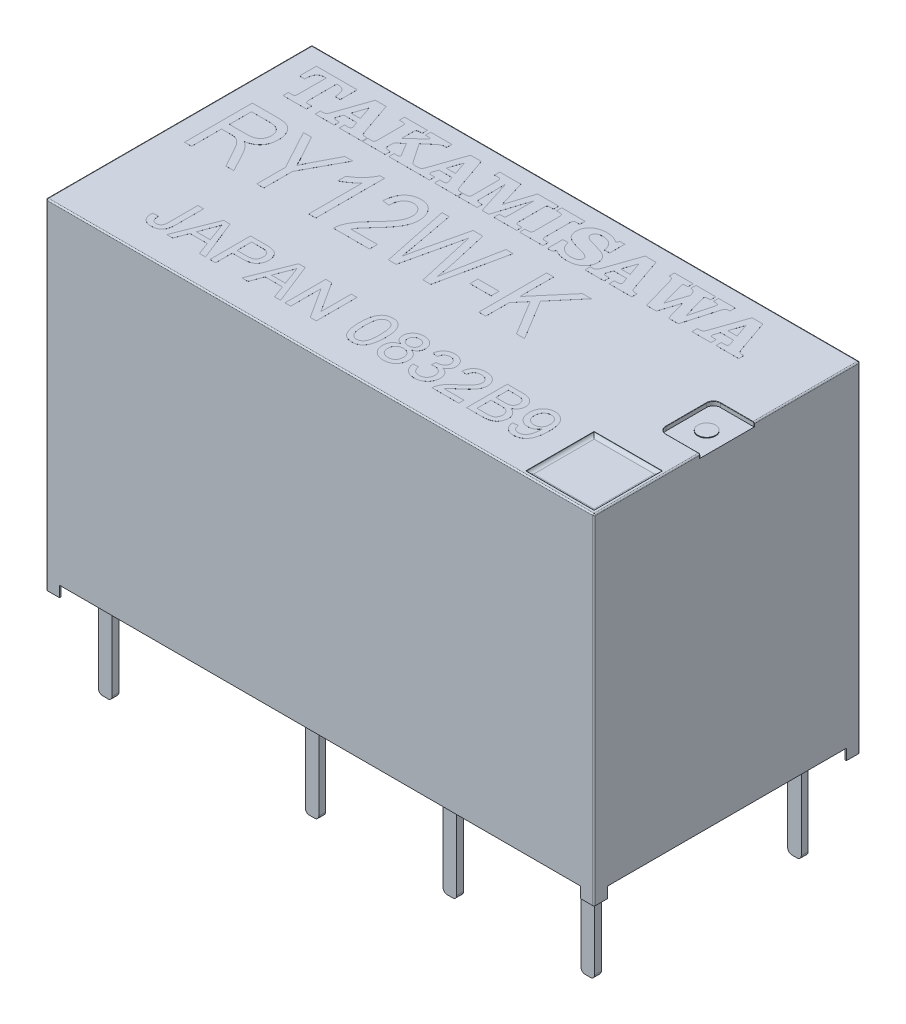
from build123d import *

# Parameters (mm, degrees)
MAINBODY_W          = 20.2
MAINBODY_H          = 9.8
EXTRUDE_1_DEPTH     = 12.1
EXTRUDE_3_DEPTH     = 0.4
FILLET_4_R          = 0.025
HOLE_W              = 2.5
HOLE_H              = 2.5
CUT_EXTRUDE_1_DEPTH = 0.1
CUT_EXTRUDE_2_DEPTH = 0.15
POINT_R             = 0.325
EXTRUDE_4_DEPTH     = 0.025
FILLET_5_R          = 0.05
FILLET_6_R          = 0.01
FILLET_7_R          = 0.01
CUT_EXTRUDE_3_DEPTH = 0.01
PINS_W              = 0.5
PINS_H              = 0.25
EXTRUDE_7_DEPTH     = 3.71
FILLET_13_R         = 0.025
FILLET_14_R         = 0.15
EXTRUDE_8_DEPTH     = 0.001
TEXTMODEL_W         = 0.779220779
TEXTMODEL_H         = 0.292207792
EXTRUDE_9_DEPTH     = 0.001
EXTRUDE_10_DEPTH    = 0.001
FILLET_15_R         = 0.15


with BuildPart() as part:
    # MainBody → Бобышка-Вытянуть1 (new body)
    with BuildSketch(Plane(origin=(0, 0, 0), x_dir=(1, 0, 0), z_dir=(0, 1, 0))):
        Rectangle(MAINBODY_W, MAINBODY_H)
    extrude(amount=EXTRUDE_1_DEPTH)

    # Supports → Бобышка-Вытянуть3 (add)
    with BuildSketch(Plane(origin=(0, 0, 0), x_dir=(1, 0, 0), z_dir=(0, 1, 0))):
        Polygon((-10.1, -4.9), (-10.1, -4.4), (-10.05, -4.4), (-9.6, -4.85), (-9.6, -4.9), align=None)
        Polygon((-10.1, 4.4), (-10.05, 4.4), (-9.6, 4.85), (-9.6, 4.9), (-10.1, 4.9), align=None)
        Polygon((9.6, -4.85), (9.6, -4.9), (10.1, -4.9), (10.1, -4.4), (10.05, -4.4), align=None)
        Polygon((9.6, 4.9), (10.1, 4.9), (10.1, 4.4), (10.05, 4.4), (9.6, 4.85), align=None)
    extrude(amount=-EXTRUDE_3_DEPTH)

    # Скругление4
    fillet_4_edges = [part.edges().sort_by_distance(p)[0] for p in [
        (9.6, 0, -4.875),
        (10.075, 0, -4.4),
        (-9.6, 0, -4.875),
        (-10.075, 0, -4.4),
        (-9.6, 0, 4.875),
        (-10.075, 0, 4.4),
        (10.075, 0, 4.4),
        (9.6, 0, 4.875),
    ]]
    fillet(fillet_4_edges, radius=FILLET_4_R)

    # Hole → Вырез-Вытянуть1 (cut)
    with BuildSketch(Plane(origin=(0, 12.1, 0), x_dir=(1, 0, 0), z_dir=(0, 1, 0))):
        with Locations((8.7, -3.5)):
            Rectangle(HOLE_W, HOLE_H)
    extrude(amount=-CUT_EXTRUDE_1_DEPTH, mode=Mode.SUBTRACT)

    # Notch → Вырез-Вытянуть2 (cut)
    with BuildSketch(Plane(origin=(0, 12.1, 0), x_dir=(1, 0, 0), z_dir=(0, 1, 0))):
        with BuildLine():
            Line((10.1, -1), (10.1, 1))
            Line((10.1, 1), (8.85, 1))
            ThreePointArc((8.85, 1), (8.673223305, 0.926776695), (8.6, 0.75))
            Line((8.6, 0.75), (8.6, -0.75))
            ThreePointArc((8.6, -0.75), (8.673223305, -0.926776695), (8.85, -1))
            Line((8.85, -1), (10.1, -1))
        make_face()
    extrude(amount=-CUT_EXTRUDE_2_DEPTH, mode=Mode.SUBTRACT)

    # Point → Бобышка-Вытянуть4 (add)
    with BuildSketch(Plane(origin=(0, 11.95, 0), x_dir=(1, 0, 0), z_dir=(0, 1, 0))):
        with Locations((9.35, 0)):
            Circle(POINT_R)
    extrude(amount=EXTRUDE_4_DEPTH)

    # Скругление5
    fillet_5_edges = [part.edges().sort_by_distance(p)[0] for p in [
        (-10.1, 12.1, 0),
        (-10.1, 5.85, 4.9),
        (-10.1, 5.85, -4.9),
        (0, 12.1, -4.9),
        (0, 12.1, 4.9),
        (10.1, 12.1, -2.95),
        (10.1, 12.1, 2.95),
        (10.1, 5.85, -4.9),
        (10.1, 5.85, 4.9),
    ]]
    fillet(fillet_5_edges, radius=FILLET_5_R)

    # Скругление6
    fillet_6_edges = [part.edges().sort_by_distance(p)[0] for p in [
        (8.673223305, 12.1, -0.926776695),
        (8.6, 12.1, 0),
        (8.673223305, 12.1, 0.926776695),
        (9.45, 12.1, 1),
        (10.085355339, 12.085355339, 1),
        (10.1, 12, 1),
        (9.45, 12.1, -1),
        (10.085355339, 12.085355339, -1),
        (10.1, 12, -1),
    ]]
    fillet(fillet_6_edges, radius=FILLET_6_R)

    # Скругление7
    fillet_7_edges = [part.edges().sort_by_distance(p)[0] for p in [
        (9.95, 12.1, 3.5),
        (8.7, 12.1, 2.25),
        (8.7, 12.1, 4.75),
        (7.45, 12.1, 3.5),
    ]]
    fillet(fillet_7_edges, radius=FILLET_7_R)

    # Bottom → Вырез-Вытянуть3 (cut)
    with BuildSketch(Plane.XZ):
        Polygon((-10.075, 4.375), (-9.575, 4.875), (9.575, 4.875), (10.075, 4.375), (10.075, -4.375), (9.575, -4.875), (-9.575, -4.875), (-10.075, -4.375), align=None)
    extrude(amount=-CUT_EXTRUDE_3_DEPTH, mode=Mode.SUBTRACT)

    # Pins → Бобышка-Вытянуть7 (add)
    with BuildSketch(Plane.XZ.offset(-0.01)):
        with Locations((-8.88, 3.81)):
            Rectangle(PINS_W, PINS_H)
        with Locations((-1.26, 3.81)):
            Rectangle(PINS_W, PINS_H)
        with Locations((3.82, 3.81)):
            Rectangle(PINS_W, PINS_H)
        with Locations((8.9, 3.81)):
            Rectangle(PINS_W, PINS_H)
        with Locations((8.9, -3.81)):
            Rectangle(PINS_W, PINS_H)
        with Locations((3.82, -3.81)):
            Rectangle(PINS_W, PINS_H)
        with Locations((-1.26, -3.81)):
            Rectangle(PINS_W, PINS_H)
        with Locations((-8.88, -3.81)):
            Rectangle(PINS_W, PINS_H)
    extrude(amount=EXTRUDE_7_DEPTH)

    # Скругление13
    fillet_13_edges = [part.edges().sort_by_distance(p)[0] for p in [
        (-8.63, 0.01, -3.81),
        (-8.88, 0.01, -3.685),
        (-8.88, 0.01, -3.935),
        (-9.13, 0.01, -3.81),
        (-8.63, 0.01, 3.81),
        (-8.88, 0.01, 3.685),
        (-8.88, 0.01, 3.935),
        (-9.13, 0.01, 3.81),
        (-1.01, 0.01, 3.81),
        (-1.26, 0.01, 3.685),
        (-1.26, 0.01, 3.935),
        (-1.51, 0.01, 3.81),
        (4.07, 0.01, 3.81),
        (3.82, 0.01, 3.935),
        (3.82, 0.01, 3.685),
        (3.57, 0.01, 3.81),
        (8.9, 0.01, 3.685),
        (8.65, 0.01, 3.81),
        (8.9, 0.01, 3.935),
        (9.15, 0.01, 3.81),
        (9.15, 0.01, -3.81),
        (8.9, 0.01, -3.685),
        (8.9, 0.01, -3.935),
        (8.65, 0.01, -3.81),
        (3.57, 0.01, -3.81),
        (3.82, 0.01, -3.935),
        (4.07, 0.01, -3.81),
        (3.82, 0.01, -3.685),
        (-1.01, 0.01, -3.81),
        (-1.26, 0.01, -3.685),
        (-1.26, 0.01, -3.935),
        (-1.51, 0.01, -3.81),
    ]]
    fillet(fillet_13_edges, radius=FILLET_13_R)

    # Скругление14
    fillet_14_edges = [part.edges().sort_by_distance(p)[0] for p in [
        (-8.63, -3.7, 3.81),
        (-9.13, -3.7, 3.81),
        (-8.63, -3.7, -3.81),
        (-9.13, -3.7, -3.81),
        (-1.51, -3.7, -3.81),
        (-1.01, -3.7, -3.81),
        (3.57, -3.7, -3.81),
        (4.07, -3.7, -3.81),
        (8.65, -3.7, -3.81),
        (9.15, -3.7, -3.81),
        (9.15, -3.7, 3.81),
        (8.65, -3.7, 3.81),
        (4.07, -3.7, 3.81),
        (3.57, -3.7, 3.81),
        (-1.01, -3.7, 3.81),
        (-1.51, -3.7, 3.81),
    ]]
    fillet(fillet_14_edges, radius=FILLET_14_R)

    # TextName → Бобышка-Вытянуть8 (add)
    # profile 1 of 10: a face of its own
    with BuildSketch(Plane(origin=(0, 12.1, 0), x_dir=(1, 0, 0), z_dir=(0, 1, 0))):
        with BuildLine():
            Line((-8.774223232, 4.104243901), (-8.798441982, 4.104243901))
            add(Edge.make_bspline(
                [(-8.798441982, 4.104243901), (-8.813143585, 4.103919996), (-8.841505177, 4.103295136), (-8.882362864, 4.098562698), (-8.919991335, 4.090886131), (-8.954580259, 4.080200513), (-8.986129975, 4.066170823), (-9.014134903, 4.048371436), (-9.0395277, 4.028240544), (-9.061174585, 4.004151952), (-9.080423628, 3.976851089), (-9.096368955, 3.945370416), (-9.109764877, 3.909883613), (-9.121218084, 3.870561357), (-9.129837685, 3.826998177), (-9.135683812, 3.779439125), (-9.139428125, 3.727903594), (-9.139933513, 3.692195677), (-9.140195454, 3.673688345)],
                knots=[0, 0, 0, 0, 1.109201541, 2.139815711, 3.098939415, 4.003438593, 4.866836507, 5.695542125, 6.501607571, 7.304112639, 8.130352574, 9.015854693, 9.958642403, 10.989534385, 12.102955336, 13.30564198, 14.603520439, 16, 16, 16, 16], degree=3))
            Line((-9.140195454, 3.673688345), (-9.333945454, 3.673688345))
            Line((-9.333945454, 3.673688345), (-9.333945454, 4.297993901))
            Line((-9.333945454, 4.297993901), (-7.82700101, 4.297993901))
            Line((-7.82700101, 4.297993901), (-7.82700101, 3.673688345))
            Line((-7.82700101, 3.673688345), (-8.02075101, 3.673688345))
            add(Edge.make_bspline(
                [(-8.02075101, 3.673688345), (-8.021010684, 3.692419982), (-8.021510359, 3.728464147), (-8.025263969, 3.780447005), (-8.031110128, 3.82834237), (-8.039710832, 3.872130509), (-8.051099431, 3.911638072), (-8.064892798, 3.946921917), (-8.080960937, 3.978239497), (-8.099969196, 4.005522194), (-8.121895187, 4.029079568), (-8.146616246, 4.049608856), (-8.175057029, 4.066347067), (-8.206327279, 4.080602906), (-8.240969223, 4.091178449), (-8.278555859, 4.099011552), (-8.319468438, 4.103170413), (-8.347807904, 4.10387731), (-8.362504482, 4.104243901)],
                knots=[0, 0, 0, 0, 1.412070216, 2.717162065, 3.927105485, 5.047769176, 6.077693654, 7.022663965, 7.899832011, 8.725296511, 9.520830247, 10.319590951, 11.138668361, 12.001255967, 12.904906263, 13.863129819, 14.891839456, 16, 16, 16, 16], degree=3))
            Line((-8.362504482, 4.104243901), (-8.386723232, 4.104243901))
            Line((-8.386723232, 4.104243901), (-8.386723232, 3.082683571))
            add(Edge.make_bspline(
                [(-8.386723232, 3.082683571), (-8.386580035, 3.068542654), (-8.386323418, 3.043201276), (-8.382022895, 3.009295842), (-8.37576596, 2.983849401), (-8.365458194, 2.964384798), (-8.346585389, 2.953302739), (-8.32123252, 2.946657154), (-8.287530749, 2.942087473), (-8.262169916, 2.941866282), (-8.248138162, 2.941743901)],
                knots=[0, 0, 0, 0, 1.4037014, 2.515517692, 3.382752414, 4.007199697, 4.634123971, 5.48308082, 6.607427827, 8, 8, 8, 8], degree=3))
            Line((-8.248138162, 2.941743901), (-8.149917676, 2.941743901))
            Line((-8.149917676, 2.941743901), (-8.149917676, 2.747993901))
            Line((-8.149917676, 2.747993901), (-9.011028787, 2.747993901))
            Line((-9.011028787, 2.747993901), (-9.011028787, 2.941743901))
            Line((-9.011028787, 2.941743901), (-8.913817416, 2.941743901))
            add(Edge.make_bspline(
                [(-8.913817416, 2.941743901), (-8.899559194, 2.941855666), (-8.873970154, 2.94205625), (-8.840064043, 2.946665478), (-8.814663562, 2.95328136), (-8.795863479, 2.964473269), (-8.785075763, 2.983718615), (-8.778970336, 3.009324908), (-8.774606206, 3.04319081), (-8.774360397, 3.068538905), (-8.774223232, 3.082683571)],
                knots=[0, 0, 0, 0, 1.409880515, 2.530293664, 3.376280189, 4.001010985, 4.629083136, 5.493283584, 6.601209861, 8, 8, 8, 8], degree=3))
            Line((-8.774223232, 3.082683571), (-8.774223232, 4.104243901))
        make_face()
    # profile 2 of 10: a face of its own
    with BuildSketch(Plane(origin=(0, 12.1, 0), x_dir=(1, 0, 0), z_dir=(0, 1, 0))):
        with BuildLine():
            Line((-6.165998406, 2.941743901), (-6.104778787, 2.941743901))
            Line((-6.104778787, 2.941743901), (-6.104778787, 2.747993901))
            Line((-6.104778787, 2.747993901), (-6.939316548, 2.747993901))
            Line((-6.939316548, 2.747993901), (-6.939316548, 2.941743901))
            Line((-6.939316548, 2.941743901), (-6.855223666, 2.941743901))
            add(Edge.make_bspline(
                [(-6.855223666, 2.941743901), (-6.841992637, 2.941946763), (-6.817851851, 2.942316898), (-6.785384874, 2.944608324), (-6.760300139, 2.949100365), (-6.741429733, 2.955374539), (-6.728547151, 2.965869484), (-6.719426071, 2.978680272), (-6.714383593, 2.994995475), (-6.713881248, 3.006741531), (-6.713611253, 3.013054665)],
                knots=[0, 0, 0, 0, 1.748513689, 3.190265438, 4.291330188, 5.116622073, 5.780574078, 6.450448467, 7.167165004, 8, 8, 8, 8], degree=3))
            add(Edge.make_bspline(
                [(-6.713611253, 3.013054665), (-6.713815516, 3.017334852), (-6.71428889, 3.027254045), (-6.718691333, 3.043506367), (-6.723745612, 3.063652639), (-6.728934044, 3.0779057), (-6.731775315, 3.085710915)],
                knots=[0, 0, 0, 0, 0.682300949, 1.581209909, 2.675430081, 4, 4, 4, 4], degree=3))
            Line((-6.731775315, 3.085710915), (-6.789631218, 3.24313279))
            Line((-6.789631218, 3.24313279), (-7.265933301, 3.24313279))
            Line((-7.265933301, 3.24313279), (-7.323452833, 3.079319856))
            add(Edge.make_bspline(
                [(-7.323452833, 3.079319856), (-7.326506385, 3.070844402), (-7.331837367, 3.056047705), (-7.337223954, 3.035889009), (-7.339697083, 3.020066745), (-7.340325553, 3.010817278), (-7.340607781, 3.006663606)],
                knots=[0, 0, 0, 0, 1.441472691, 2.516565529, 3.333831875, 4, 4, 4, 4], degree=3))
            add(Edge.make_bspline(
                [(-7.340607781, 3.006663606), (-7.340384338, 3.000813437), (-7.33996963, 2.989955578), (-7.33609782, 2.9749031), (-7.328805596, 2.96312064), (-7.318501259, 2.953568594), (-7.302732949, 2.948129213), (-7.282008302, 2.944605512), (-7.255010201, 2.941777669), (-7.234994812, 2.941755953), (-7.22388686, 2.941743901)],
                knots=[0, 0, 0, 0, 0.90469741, 1.679110249, 2.372330679, 3.023470704, 3.809454096, 4.904913959, 6.282318279, 8, 8, 8, 8], degree=3))
            Line((-7.22388686, 2.941743901), (-7.123984517, 2.941743901))
            Line((-7.123984517, 2.941743901), (-7.123984517, 2.747993901))
            Line((-7.123984517, 2.747993901), (-7.82700101, 2.747993901))
            Line((-7.82700101, 2.747993901), (-7.82700101, 2.941743901))
            Line((-7.82700101, 2.941743901), (-7.748962815, 2.941743901))
            add(Edge.make_bspline(
                [(-7.748962815, 2.941743901), (-7.738729821, 2.94212057), (-7.719100215, 2.94284312), (-7.691275351, 2.948596497), (-7.666510838, 2.957918811), (-7.644394676, 2.972097863), (-7.624331352, 2.992900203), (-7.606372626, 3.021779122), (-7.5884947, 3.058427042), (-7.578473372, 3.08615295), (-7.573040506, 3.101184005)],
                knots=[0, 0, 0, 0, 0.946955424, 1.816512522, 2.618671765, 3.38480666, 4.229201259, 5.271753899, 6.520935176, 8, 8, 8, 8], degree=3))
            Line((-7.573040506, 3.101184005), (-7.161321756, 4.297993901))
            Line((-7.161321756, 4.297993901), (-6.762385124, 4.297993901))
            Line((-6.762385124, 4.297993901), (-6.346293544, 3.094792946))
            add(Edge.make_bspline(
                [(-6.346293544, 3.094792946), (-6.340670938, 3.079574418), (-6.330422857, 3.051836264), (-6.313704497, 3.015299955), (-6.298044388, 2.987553757), (-6.281383493, 2.967319687), (-6.260165209, 2.955034384), (-6.234192352, 2.947395672), (-6.202171311, 2.942485205), (-6.178689356, 2.942003981), (-6.165998406, 2.941743901)],
                knots=[0, 0, 0, 0, 1.479568473, 2.696745618, 3.659687773, 4.384167369, 5.054191873, 5.859554914, 6.843184756, 8, 8, 8, 8], degree=3))
        make_face()
        Polygon((-6.853205437, 3.43688279), (-7.026436774, 3.939758224), (-7.198995367, 3.43688279), align=None, mode=Mode.SUBTRACT)
    # profile 3 of 10: a face of its own
    with BuildSketch(Plane(origin=(0, 12.1, 0), x_dir=(1, 0, 0), z_dir=(0, 1, 0))):
        with BuildLine():
            Line((-5.23996759, 4.297993901), (-5.23996759, 4.104243901))
            Line((-5.23996759, 4.104243901), (-5.307914638, 4.104243901))
            add(Edge.make_bspline(
                [(-5.307914638, 4.104243901), (-5.316099512, 4.104174594), (-5.33157936, 4.104043514), (-5.353710437, 4.103199345), (-5.373198885, 4.101032393), (-5.390456064, 4.098904939), (-5.40505671, 4.095539523), (-5.417507529, 4.091694135), (-5.427218083, 4.086561422), (-5.438203791, 4.079135726), (-5.447358477, 4.06256127), (-5.454030234, 4.036748504), (-5.458607905, 4.002236966), (-5.458825071, 3.97632354), (-5.458945454, 3.961958745)],
                knots=[0, 0, 0, 0, 1.157141415, 2.188472862, 3.128432093, 3.928649051, 4.643823056, 5.245279357, 5.76276873, 6.193928958, 7.099587371, 8.33840648, 9.970239685, 12, 12, 12, 12], degree=3))
            Line((-5.458945454, 3.961958745), (-5.458945454, 3.563358484))
            Line((-5.458945454, 3.563358484), (-4.967506652, 4.016787304))
            add(Edge.make_bspline(
                [(-4.967506652, 4.016787304), (-4.962629445, 4.021348931), (-4.953876409, 4.029535602), (-4.944023373, 4.042820055), (-4.937530805, 4.055459417), (-4.936871444, 4.06415233), (-4.936560471, 4.068252147)],
                knots=[0, 0, 0, 0, 1.29360933, 2.321617212, 3.208428299, 4, 4, 4, 4], degree=3))
            add(Edge.make_bspline(
                [(-4.936560471, 4.068252147), (-4.936677877, 4.071329294), (-4.936899723, 4.077143767), (-4.940709289, 4.084980241), (-4.946087937, 4.091591921), (-4.954276956, 4.096499251), (-4.965243691, 4.100148457), (-4.979736867, 4.102678862), (-4.997989131, 4.103732268), (-5.011346549, 4.104063281), (-5.018635124, 4.104243901)],
                knots=[0, 0, 0, 0, 0.729148712, 1.377774715, 2.044474806, 2.744385112, 3.627264875, 4.801203568, 6.254552564, 8, 8, 8, 8], degree=3))
            Line((-5.018635124, 4.104243901), (-5.118201096, 4.104243901))
            Line((-5.118201096, 4.104243901), (-5.118201096, 4.297993901))
            Line((-5.118201096, 4.297993901), (-4.33950101, 4.297993901))
            Line((-4.33950101, 4.297993901), (-4.33950101, 4.104243901))
            Line((-4.33950101, 4.104243901), (-4.397693284, 4.104243901))
            add(Edge.make_bspline(
                [(-4.397693284, 4.104243901), (-4.407810196, 4.103941319), (-4.427946428, 4.103339073), (-4.45796502, 4.097785121), (-4.487909592, 4.090100321), (-4.517545889, 4.077738406), (-4.547873234, 4.062478289), (-4.579279718, 4.042998954), (-4.612138856, 4.019571987), (-4.633719713, 4.001576824), (-4.644926357, 3.992232182)],
                knots=[0, 0, 0, 0, 0.874391208, 1.740347577, 2.634531601, 3.544208839, 4.511636108, 5.569746744, 6.73800267, 8, 8, 8, 8], degree=3))
            Line((-4.644926357, 3.992232182), (-4.965152051, 3.719098502))
            Line((-4.965152051, 3.719098502), (-4.50465943, 3.040300759))
            add(Edge.make_bspline(
                [(-4.50465943, 3.040300759), (-4.498776334, 3.031981044), (-4.487571741, 3.016135813), (-4.468774692, 2.995458012), (-4.450065347, 2.978201776), (-4.430888966, 2.964269356), (-4.410581233, 2.95390052), (-4.388853292, 2.947006954), (-4.365821699, 2.942372167), (-4.349952076, 2.941956148), (-4.34185561, 2.941743901)],
                knots=[0, 0, 0, 0, 1.226253212, 2.33544845, 3.358334494, 4.287708828, 5.181572845, 6.09121215, 7.026162487, 8, 8, 8, 8], degree=3))
            Line((-4.34185561, 2.941743901), (-4.253389899, 2.941743901))
            Line((-4.253389899, 2.941743901), (-4.253389899, 2.747993901))
            Line((-4.253389899, 2.747993901), (-5.11450101, 2.747993901))
            Line((-5.11450101, 2.747993901), (-5.11450101, 2.941743901))
            Line((-5.11450101, 2.941743901), (-5.030071756, 2.941743901))
            add(Edge.make_bspline(
                [(-5.030071756, 2.941743901), (-5.020198576, 2.941828901), (-5.002109648, 2.941984633), (-4.977302513, 2.944128721), (-4.957045779, 2.946725921), (-4.940994384, 2.951262884), (-4.928955979, 2.957877205), (-4.919991134, 2.965948308), (-4.914972185, 2.97648713), (-4.914346558, 2.9839659), (-4.914023579, 2.9878268)],
                knots=[0, 0, 0, 0, 1.716697218, 3.145208782, 4.328473203, 5.266235595, 6.025847369, 6.701728623, 7.329770027, 8, 8, 8, 8], degree=3))
            add(Edge.make_bspline(
                [(-4.914023579, 2.9878268), (-4.914214026, 2.991437352), (-4.914595748, 2.99867415), (-4.917954723, 3.009603595), (-4.923771116, 3.021364303), (-4.929147793, 3.029163719), (-4.932187642, 3.033573328)],
                knots=[0, 0, 0, 0, 0.863975265, 1.731706055, 2.717559345, 4, 4, 4, 4], degree=3))
            Line((-4.932187642, 3.033573328), (-5.208012294, 3.489356748))
            Line((-5.208012294, 3.489356748), (-5.458945454, 3.274415342))
            Line((-5.458945454, 3.274415342), (-5.458945454, 3.084029057))
            add(Edge.make_bspline(
                [(-5.458945454, 3.084029057), (-5.458825085, 3.069664192), (-5.458607944, 3.043750641), (-5.454030123, 3.009239844), (-5.447358752, 2.983425183), (-5.438203218, 2.96685489), (-5.427219103, 2.959421368), (-5.417502396, 2.954318877), (-5.405103733, 2.950335871), (-5.390371416, 2.947652493), (-5.373246884, 2.944767351), (-5.35370056, 2.942848063), (-5.33158229, 2.941926603), (-5.316100525, 2.941807092), (-5.307914638, 2.941743901)],
                knots=[0, 0, 0, 0, 2.029928425, 3.661896781, 4.900818491, 5.806551913, 6.237747851, 6.755280083, 7.356786199, 8.068674326, 8.871308804, 9.811345884, 10.842762748, 12, 12, 12, 12], degree=3))
            Line((-5.307914638, 2.941743901), (-5.243667676, 2.941743901))
            Line((-5.243667676, 2.941743901), (-5.243667676, 2.747993901))
            Line((-5.243667676, 2.747993901), (-6.08325101, 2.747993901))
            Line((-6.08325101, 2.747993901), (-6.08325101, 2.941743901))
            Line((-6.08325101, 2.941743901), (-5.994785298, 2.941743901))
            add(Edge.make_bspline(
                [(-5.994785298, 2.941743901), (-5.986823893, 2.941808603), (-5.97179084, 2.941930777), (-5.950340904, 2.942829245), (-5.931365696, 2.94482703), (-5.914640829, 2.947539876), (-5.900284746, 2.95068408), (-5.888277314, 2.954854939), (-5.878327837, 2.959209215), (-5.867985621, 2.967658567), (-5.858340945, 2.983817647), (-5.851210121, 3.009775345), (-5.847359731, 3.044114574), (-5.84677184, 3.06978007), (-5.846445454, 3.084029057)],
                knots=[0, 0, 0, 0, 1.140197449, 2.152967929, 3.073303762, 3.870540138, 4.579439465, 5.173567941, 5.690660184, 6.124510657, 7.064253295, 8.323925047, 9.959114295, 12, 12, 12, 12], degree=3))
            Line((-5.846445454, 3.084029057), (-5.846445454, 3.961958745))
            add(Edge.make_bspline(
                [(-5.846445454, 3.961958745), (-5.846779392, 3.976204538), (-5.847380885, 4.001864281), (-5.85113913, 4.036130676), (-5.858426292, 4.061900881), (-5.867960618, 4.07803961), (-5.878407552, 4.086394461), (-5.888173276, 4.091229304), (-5.900304102, 4.095265161), (-5.91463452, 4.098460496), (-5.931367769, 4.101156643), (-5.950340255, 4.10315985), (-5.971791033, 4.104056639), (-5.98682396, 4.104179065), (-5.994785298, 4.104243901)],
                knots=[0, 0, 0, 0, 2.042274877, 3.678577151, 4.923752922, 5.864135217, 6.298280999, 6.82291056, 7.417443443, 8.126825297, 8.924604329, 9.845566608, 10.859026451, 12, 12, 12, 12], degree=3))
            Line((-5.994785298, 4.104243901), (-6.08325101, 4.104243901))
            Line((-6.08325101, 4.104243901), (-6.08325101, 4.297993901))
            Line((-6.08325101, 4.297993901), (-5.23996759, 4.297993901))
        make_face()
    # profile 4 of 10: a face of its own
    with BuildSketch(Plane(origin=(0, 12.1, 0), x_dir=(1, 0, 0), z_dir=(0, 1, 0))):
        with BuildLine():
            Line((-2.656970628, 2.941743901), (-2.59575101, 2.941743901))
            Line((-2.59575101, 2.941743901), (-2.59575101, 2.747993901))
            Line((-2.59575101, 2.747993901), (-3.43028877, 2.747993901))
            Line((-3.43028877, 2.747993901), (-3.43028877, 2.941743901))
            Line((-3.43028877, 2.941743901), (-3.346195888, 2.941743901))
            add(Edge.make_bspline(
                [(-3.346195888, 2.941743901), (-3.332964859, 2.941946763), (-3.308824073, 2.942316898), (-3.276357096, 2.944608324), (-3.251272361, 2.949100365), (-3.232401955, 2.955374539), (-3.219519373, 2.965869484), (-3.210398293, 2.978680272), (-3.205355816, 2.994995475), (-3.20485347, 3.006741531), (-3.204583475, 3.013054665)],
                knots=[0, 0, 0, 0, 1.748513689, 3.190265438, 4.291330188, 5.116622073, 5.780574078, 6.450448467, 7.167165004, 8, 8, 8, 8], degree=3))
            add(Edge.make_bspline(
                [(-3.204583475, 3.013054665), (-3.204787738, 3.017334852), (-3.205261112, 3.027254045), (-3.209663555, 3.043506367), (-3.214717835, 3.063652639), (-3.219906266, 3.0779057), (-3.222747537, 3.085710915)],
                knots=[0, 0, 0, 0, 0.682300949, 1.581209909, 2.675430081, 4, 4, 4, 4], degree=3))
            Line((-3.222747537, 3.085710915), (-3.28060344, 3.24313279))
            Line((-3.28060344, 3.24313279), (-3.756905524, 3.24313279))
            Line((-3.756905524, 3.24313279), (-3.814425055, 3.079319856))
            add(Edge.make_bspline(
                [(-3.814425055, 3.079319856), (-3.817478607, 3.070844402), (-3.822809589, 3.056047705), (-3.828196176, 3.035889009), (-3.830669306, 3.020066745), (-3.831297775, 3.010817278), (-3.831580003, 3.006663606)],
                knots=[0, 0, 0, 0, 1.441472691, 2.516565529, 3.333831875, 4, 4, 4, 4], degree=3))
            add(Edge.make_bspline(
                [(-3.831580003, 3.006663606), (-3.83135656, 3.000813437), (-3.830941852, 2.989955578), (-3.827070043, 2.9749031), (-3.819777819, 2.96312064), (-3.809473481, 2.953568594), (-3.793705172, 2.948129213), (-3.772980525, 2.944605512), (-3.745982424, 2.941777669), (-3.725967035, 2.941755953), (-3.714859083, 2.941743901)],
                knots=[0, 0, 0, 0, 0.90469741, 1.679110249, 2.372330679, 3.023470704, 3.809454096, 4.904913959, 6.282318279, 8, 8, 8, 8], degree=3))
            Line((-3.714859083, 2.941743901), (-3.614956739, 2.941743901))
            Line((-3.614956739, 2.941743901), (-3.614956739, 2.747993901))
            Line((-3.614956739, 2.747993901), (-4.317973232, 2.747993901))
            Line((-4.317973232, 2.747993901), (-4.317973232, 2.941743901))
            Line((-4.317973232, 2.941743901), (-4.239935037, 2.941743901))
            add(Edge.make_bspline(
                [(-4.239935037, 2.941743901), (-4.229702043, 2.94212057), (-4.210072437, 2.94284312), (-4.182247573, 2.948596497), (-4.15748306, 2.957918811), (-4.135366898, 2.972097863), (-4.115303574, 2.992900203), (-4.097344849, 3.021779122), (-4.079466922, 3.058427042), (-4.069445594, 3.08615295), (-4.064012728, 3.101184005)],
                knots=[0, 0, 0, 0, 0.946955424, 1.816512522, 2.618671765, 3.38480666, 4.229201259, 5.271753899, 6.520935176, 8, 8, 8, 8], degree=3))
            Line((-4.064012728, 3.101184005), (-3.652293978, 4.297993901))
            Line((-3.652293978, 4.297993901), (-3.253357346, 4.297993901))
            Line((-3.253357346, 4.297993901), (-2.837265767, 3.094792946))
            add(Edge.make_bspline(
                [(-2.837265767, 3.094792946), (-2.831643161, 3.079574418), (-2.821395079, 3.051836264), (-2.80467672, 3.015299955), (-2.78901661, 2.987553757), (-2.772355715, 2.967319687), (-2.751137431, 2.955034384), (-2.725164575, 2.947395672), (-2.693143533, 2.942485205), (-2.669661578, 2.942003981), (-2.656970628, 2.941743901)],
                knots=[0, 0, 0, 0, 1.479568473, 2.696745618, 3.659687773, 4.384167369, 5.054191873, 5.859554914, 6.843184756, 8, 8, 8, 8], degree=3))
        make_face()
        Polygon((-3.344177659, 3.43688279), (-3.517408996, 3.939758224), (-3.68996759, 3.43688279), align=None, mode=Mode.SUBTRACT)
    # profile 5 of 10: a face of its own
    with BuildSketch(Plane(origin=(0, 12.1, 0), x_dir=(1, 0, 0), z_dir=(0, 1, 0))):
        with BuildLine():
            Line((-0.399917676, 4.297993901), (-0.399917676, 4.104243901))
            Line((-0.399917676, 4.104243901), (-0.489056131, 4.104243901))
            add(Edge.make_bspline(
                [(-0.489056131, 4.104243901), (-0.496904025, 4.104167519), (-0.511934281, 4.104021231), (-0.533290259, 4.10325499), (-0.552308517, 4.100936629), (-0.56904665, 4.099016379), (-0.583359294, 4.095410749), (-0.595563065, 4.091798849), (-0.605058887, 4.08646646), (-0.615992971, 4.079157772), (-0.625130791, 4.062550706), (-0.631810226, 4.036752784), (-0.636384892, 4.002235437), (-0.636602566, 3.976322995), (-0.636723232, 3.961958745)],
                knots=[0, 0, 0, 0, 1.124170728, 2.153007557, 3.057399137, 3.868126515, 4.561413226, 5.170769332, 5.680846054, 6.11766934, 7.035223089, 8.29031342, 9.943579875, 12, 12, 12, 12], degree=3))
            Line((-0.636723232, 3.961958745), (-0.636723232, 3.084029057))
            add(Edge.make_bspline(
                [(-0.636723232, 3.084029057), (-0.636602582, 3.069664734), (-0.636384935, 3.04375216), (-0.631810104, 3.009235591), (-0.625131092, 2.983435681), (-0.615992343, 2.966832983), (-0.605059991, 2.959516146), (-0.595557615, 2.954214612), (-0.583409242, 2.950461232), (-0.56895901, 2.947541808), (-0.55235585, 2.944870616), (-0.533280377, 2.942791342), (-0.511937164, 2.941949493), (-0.496905014, 2.941814425), (-0.489056131, 2.941743901)],
                knots=[0, 0, 0, 0, 2.056619018, 3.710045373, 4.965257094, 5.882899588, 6.319765122, 6.829891178, 7.439306219, 8.129117209, 8.942305157, 9.846784209, 10.875720545, 12, 12, 12, 12], degree=3))
            Line((-0.489056131, 2.941743901), (-0.399917676, 2.941743901))
            Line((-0.399917676, 2.941743901), (-0.399917676, 2.747993901))
            Line((-0.399917676, 2.747993901), (-1.23950101, 2.747993901))
            Line((-1.23950101, 2.747993901), (-1.23950101, 2.941743901))
            Line((-1.23950101, 2.941743901), (-1.166508388, 2.941743901))
            add(Edge.make_bspline(
                [(-1.166508388, 2.941743901), (-1.152021397, 2.941835459), (-1.125977735, 2.942000056), (-1.091489718, 2.946842268), (-1.065440051, 2.95285292), (-1.046210256, 2.964029417), (-1.035486287, 2.983439811), (-1.028713305, 3.009232481), (-1.024711111, 3.04377846), (-1.024397292, 3.069668866), (-1.024223232, 3.084029057)],
                knots=[0, 0, 0, 0, 1.409176551, 2.533315376, 3.38370552, 4.007596358, 4.62563164, 5.479030538, 6.601736764, 8, 8, 8, 8], degree=3))
            Line((-1.024223232, 3.084029057), (-1.024223232, 4.02250562))
            Line((-1.024223232, 4.02250562), (-1.429214551, 2.747993901))
            Line((-1.429214551, 2.747993901), (-1.674093024, 2.747993901))
            Line((-1.674093024, 2.747993901), (-2.079084343, 4.02250562))
            Line((-2.079084343, 4.02250562), (-2.079084343, 3.084029057))
            add(Edge.make_bspline(
                [(-2.079084343, 3.084029057), (-2.078966091, 3.069661244), (-2.078752771, 3.043742376), (-2.074152394, 3.009262974), (-2.067538657, 2.983368094), (-2.058302331, 2.967054954), (-2.047668312, 2.959305232), (-2.038047038, 2.954411908), (-2.026036249, 2.950359011), (-2.011751373, 2.947606531), (-1.995178047, 2.944797798), (-1.976196495, 2.942838362), (-1.954860573, 2.941932972), (-1.939939401, 2.941809077), (-1.932089985, 2.941743901)],
                knots=[0, 0, 0, 0, 2.061740904, 3.719285019, 4.977622769, 5.897550596, 6.322589372, 6.848232227, 7.443913418, 8.13544234, 8.934762239, 9.857503308, 10.872920594, 12, 12, 12, 12], degree=3))
            Line((-1.932089985, 2.941743901), (-1.863806565, 2.941743901))
            Line((-1.863806565, 2.941743901), (-1.863806565, 2.747993901))
            Line((-1.863806565, 2.747993901), (-2.574223232, 2.747993901))
            Line((-2.574223232, 2.747993901), (-2.574223232, 2.941743901))
            Line((-2.574223232, 2.941743901), (-2.488784864, 2.941743901))
            add(Edge.make_bspline(
                [(-2.488784864, 2.941743901), (-2.480711934, 2.941814408), (-2.465343889, 2.941948628), (-2.443550281, 2.942780596), (-2.424147677, 2.944911533), (-2.4071577, 2.947427885), (-2.392433746, 2.950840802), (-2.380079445, 2.954686901), (-2.369952922, 2.959328109), (-2.359235883, 2.967451278), (-2.349760112, 2.983933128), (-2.342017378, 3.009670816), (-2.338392087, 3.044139925), (-2.337765529, 3.06978912), (-2.337417676, 3.084029057)],
                knots=[0, 0, 0, 0, 1.144077621, 2.177925252, 3.088569602, 3.908788397, 4.610222747, 5.228239964, 5.73988703, 6.181631231, 7.111478026, 8.362635503, 9.980605591, 12, 12, 12, 12], degree=3))
            Line((-2.337417676, 3.084029057), (-2.337417676, 3.961958745))
            add(Edge.make_bspline(
                [(-2.337417676, 3.961958745), (-2.337773325, 3.976195331), (-2.338413924, 4.00183849), (-2.341945153, 4.036236578), (-2.349845345, 4.06178527), (-2.359210693, 4.078247116), (-2.370034575, 4.086272375), (-2.379971949, 4.091404478), (-2.39245334, 4.095108016), (-2.407151149, 4.098572951), (-2.424149767, 4.101072111), (-2.443549613, 4.103208534), (-2.465344087, 4.104038781), (-2.480712002, 4.104173259), (-2.488784864, 4.104243901)],
                knots=[0, 0, 0, 0, 2.020744636, 3.639796547, 4.87665743, 5.807125948, 6.249165512, 6.76826428, 7.386694722, 8.088598071, 8.909365289, 9.820618522, 10.855157415, 12, 12, 12, 12], degree=3))
            Line((-2.488784864, 4.104243901), (-2.574223232, 4.104243901))
            Line((-2.574223232, 4.104243901), (-2.574223232, 4.297993901))
            Line((-2.574223232, 4.297993901), (-1.800232346, 4.297993901))
            Line((-1.800232346, 4.297993901), (-1.495143371, 3.304688779))
            Line((-1.495143371, 3.304688779), (-1.178617763, 4.297993901))
            Line((-1.178617763, 4.297993901), (-0.399917676, 4.297993901))
        make_face()
    # profile 6 of 10: a face of its own
    with BuildSketch(Plane(origin=(0, 12.1, 0), x_dir=(1, 0, 0), z_dir=(0, 1, 0))):
        with BuildLine():
            Line((0.568832324, 4.297993901), (0.568832324, 4.104243901))
            Line((0.568832324, 4.104243901), (0.475321039, 4.104243901))
            add(Edge.make_bspline(
                [(0.475321039, 4.104243901), (0.460738525, 4.104069789), (0.43451602, 4.103756698), (0.399613213, 4.09978773), (0.373595596, 4.092944151), (0.354031828, 4.082106556), (0.34330077, 4.062524271), (0.336512398, 4.036764947), (0.332516237, 4.002205899), (0.332201396, 3.976317707), (0.332026768, 3.961958745)],
                knots=[0, 0, 0, 0, 1.414340451, 2.543289167, 3.393232921, 4.023760343, 4.639293395, 5.489237149, 6.607397892, 8, 8, 8, 8], degree=3))
            Line((0.332026768, 3.961958745), (0.332026768, 3.084029057))
            add(Edge.make_bspline(
                [(0.332026768, 3.084029057), (0.332201286, 3.069669676), (0.332515929, 3.043780729), (0.336513259, 3.009226137), (0.343298648, 2.983455443), (0.354037459, 2.963902709), (0.373542622, 2.95296383), (0.399714555, 2.946772171), (0.434465467, 2.942024655), (0.460725671, 2.941844198), (0.475321039, 2.941743901)],
                knots=[0, 0, 0, 0, 1.392877792, 2.511259889, 3.361371901, 3.977026805, 4.607679048, 5.454793894, 6.585379562, 8, 8, 8, 8], degree=3))
            Line((0.475321039, 2.941743901), (0.568832324, 2.941743901))
            Line((0.568832324, 2.941743901), (0.568832324, 2.747993901))
            Line((0.568832324, 2.747993901), (-0.292278787, 2.747993901))
            Line((-0.292278787, 2.747993901), (-0.292278787, 2.941743901))
            Line((-0.292278787, 2.941743901), (-0.203813076, 2.941743901))
            add(Edge.make_bspline(
                [(-0.203813076, 2.941743901), (-0.195851671, 2.941808603), (-0.180818618, 2.941930777), (-0.159368682, 2.942829245), (-0.140393474, 2.94482703), (-0.123668607, 2.947539876), (-0.109312524, 2.95068408), (-0.097305092, 2.954854939), (-0.087355614, 2.959209215), (-0.077013399, 2.967658567), (-0.067368723, 2.983817647), (-0.060237899, 3.009775345), (-0.056387509, 3.044114574), (-0.055799618, 3.06978007), (-0.055473232, 3.084029057)],
                knots=[0, 0, 0, 0, 1.140197449, 2.152967929, 3.073303762, 3.870540138, 4.579439465, 5.173567941, 5.690660184, 6.124510657, 7.064253295, 8.323925047, 9.959114295, 12, 12, 12, 12], degree=3))
            Line((-0.055473232, 3.084029057), (-0.055473232, 3.961958745))
            add(Edge.make_bspline(
                [(-0.055473232, 3.961958745), (-0.055807169, 3.976204538), (-0.056408663, 4.001864281), (-0.060166908, 4.036130676), (-0.06745407, 4.061900881), (-0.076988395, 4.07803961), (-0.08743533, 4.086394461), (-0.097201054, 4.091229304), (-0.109331879, 4.095265161), (-0.123662297, 4.098460496), (-0.140395547, 4.101156643), (-0.159368033, 4.10315985), (-0.180818811, 4.104056639), (-0.195851738, 4.104179065), (-0.203813076, 4.104243901)],
                knots=[0, 0, 0, 0, 2.042274877, 3.678577151, 4.923752922, 5.864135217, 6.298280999, 6.82291056, 7.417443443, 8.126825297, 8.924604329, 9.845566608, 10.859026451, 12, 12, 12, 12], degree=3))
            Line((-0.203813076, 4.104243901), (-0.292278787, 4.104243901))
            Line((-0.292278787, 4.104243901), (-0.292278787, 4.297993901))
            Line((-0.292278787, 4.297993901), (0.568832324, 4.297993901))
        make_face()
    # profile 7 of 10: a face of its own
    with BuildSketch(Plane(origin=(0, 12.1, 0), x_dir=(1, 0, 0), z_dir=(0, 1, 0))):
        with BuildLine():
            Line((0.917313226, 2.737566384), (0.741054546, 2.737566384))
            Line((0.741054546, 2.737566384), (0.741054546, 3.307716123))
            Line((0.741054546, 3.307716123), (0.934804546, 3.307716123))
            add(Edge.make_bspline(
                [(0.934804546, 3.307716123), (0.937898346, 3.292177938), (0.943992787, 3.261569444), (0.957625406, 3.217511898), (0.974160715, 3.175898611), (0.993570522, 3.136672079), (1.016596112, 3.100271303), (1.042559912, 3.06644158), (1.071743812, 3.035370763), (1.103616856, 3.006781012), (1.138136609, 2.981218813), (1.175226135, 2.959307317), (1.214151848, 2.940293974), (1.255528691, 2.925363649), (1.298613932, 2.912998737), (1.343918052, 2.90481437), (1.39124914, 2.899586151), (1.423537844, 2.898991937), (1.440034581, 2.898688345)],
                knots=[0, 0, 0, 0, 1.066612541, 2.101107896, 3.10108835, 4.080608893, 5.044514338, 5.997737988, 6.948894848, 7.911675238, 8.878446597, 9.836951636, 10.809810685, 11.791919287, 12.796168924, 13.825689652, 14.88911535, 16, 16, 16, 16], degree=3))
            add(Edge.make_bspline(
                [(1.440034581, 2.898688345), (1.461491196, 2.899182413), (1.50215244, 2.900118694), (1.559510389, 2.909367254), (1.610035345, 2.923577198), (1.646477573, 2.941754808), (1.671452684, 2.958791861), (1.687635511, 2.972303083), (1.700960396, 2.987560645), (1.712121209, 3.003493713), (1.720587416, 3.020798275), (1.727245441, 3.038860667), (1.730404877, 3.058470079), (1.731017579, 3.071799698), (1.731332324, 3.078647113)],
                knots=[0, 0, 0, 0, 2.020893281, 3.829683053, 5.461537928, 6.950398261, 7.642235318, 8.30941463, 8.930824429, 9.546455226, 10.137272819, 10.742288496, 11.353914556, 12, 12, 12, 12], degree=3))
            add(Edge.make_bspline(
                [(1.731332324, 3.078647113), (1.7310742, 3.084499058), (1.730561583, 3.096120615), (1.726373342, 3.113338499), (1.719126953, 3.12973786), (1.709604887, 3.145937106), (1.696910419, 3.161324818), (1.681784444, 3.176519513), (1.663697634, 3.190937355), (1.643051656, 3.205158826), (1.619609797, 3.21875884), (1.593430563, 3.23198444), (1.56451273, 3.244617674), (1.532933159, 3.257137984), (1.498501218, 3.268750736), (1.461542272, 3.280273981), (1.421670069, 3.290986966), (1.394080516, 3.297581222), (1.379824077, 3.300988693)],
                knots=[0, 0, 0, 0, 0.634560489, 1.260192989, 1.908828337, 2.574472203, 3.292745906, 4.067058079, 4.897459948, 5.798568043, 6.785607516, 7.835794695, 8.979764886, 10.208887135, 11.520965458, 12.921825744, 14.409405022, 16, 16, 16, 16], degree=3))
            add(Edge.make_bspline(
                [(1.379824077, 3.300988693), (1.371763494, 3.302949908), (1.357911784, 3.306320157), (1.343950814, 3.309202179), (1.338114008, 3.310407095)],
                knots=[0, 0, 0, 0, 1.163839559, 2, 2, 2, 2], degree=3))
            add(Edge.make_bspline(
                [(1.338114008, 3.310407095), (1.308911869, 3.31773283), (1.252758288, 3.331819684), (1.172673286, 3.355091139), (1.099817853, 3.378693933), (1.034600454, 3.40367435), (0.976572421, 3.428589628), (0.925989812, 3.454492112), (0.882947843, 3.481186395), (0.846423862, 3.508802112), (0.816450425, 3.538875803), (0.790068399, 3.570572207), (0.768313017, 3.605422297), (0.750201852, 3.642805287), (0.736453815, 3.683040939), (0.726915287, 3.725922496), (0.72056188, 3.771384382), (0.719878291, 3.802608195), (0.719526768, 3.818664474)],
                knots=[0, 0, 0, 0, 1.643526559, 3.160381651, 4.552175448, 5.823163042, 6.971763728, 7.998424792, 8.922393391, 9.734149864, 10.491631951, 11.235436708, 11.980977419, 12.728400463, 13.498855378, 14.296268077, 15.123886827, 16, 16, 16, 16], degree=3))
            add(Edge.make_bspline(
                [(0.719526768, 3.818664474), (0.72004755, 3.837752022), (0.721065999, 3.875079944), (0.728931663, 3.929668177), (0.742010972, 3.98146773), (0.760582699, 4.030425369), (0.784342304, 4.0765349), (0.813128685, 4.119924739), (0.847274812, 4.160486112), (0.886772586, 4.197642944), (0.930175467, 4.231425409), (0.977287761, 4.261084278), (1.028058464, 4.285347242), (1.081786565, 4.306230965), (1.139182301, 4.321909179), (1.199867644, 4.33280252), (1.263840847, 4.339727712), (1.307598008, 4.340601361), (1.330041091, 4.341049457)],
                knots=[0, 0, 0, 0, 1.013850875, 1.982703341, 2.923305454, 3.847157344, 4.758361343, 5.6737038, 6.60807876, 7.568838922, 8.549541844, 9.52641958, 10.520207267, 11.534722996, 12.585445022, 13.675619224, 14.807823247, 16, 16, 16, 16], degree=3))
            add(Edge.make_bspline(
                [(1.330041091, 4.341049457), (1.351921419, 4.340705128), (1.394770895, 4.340030811), (1.457739435, 4.333458617), (1.517878783, 4.322756119), (1.575875139, 4.307906939), (1.632118614, 4.288034336), (1.687850819, 4.263912821), (1.742788555, 4.234091992), (1.778236414, 4.21111474), (1.796252029, 4.199437043)],
                knots=[0, 0, 0, 0, 1.060255312, 2.076357618, 3.064579858, 4.01891162, 4.97454234, 5.952912448, 6.959611605, 8, 8, 8, 8], degree=3))
            Line((1.796252029, 4.199437043), (1.863526334, 4.297993901))
            Line((1.863526334, 4.297993901), (2.032721213, 4.297993901))
            Line((2.032721213, 4.297993901), (2.032721213, 3.738271679))
            Line((2.032721213, 3.738271679), (1.838971213, 3.738271679))
            add(Edge.make_bspline(
                [(1.838971213, 3.738271679), (1.836903407, 3.754243676), (1.832868337, 3.785411081), (1.82213134, 3.830336121), (1.808943141, 3.872568201), (1.791919666, 3.911783698), (1.772071433, 3.948319633), (1.749065955, 3.982102118), (1.723156891, 4.013323466), (1.693735474, 4.041195076), (1.661659654, 4.066063044), (1.627322609, 4.088269996), (1.589969494, 4.106187956), (1.550611229, 4.121606359), (1.508574276, 4.132784643), (1.464312179, 4.141300844), (1.417503302, 4.146374577), (1.385442591, 4.146986682), (1.369060188, 4.147299457)],
                knots=[0, 0, 0, 0, 1.11546209, 2.176688193, 3.196565952, 4.178156843, 5.134476636, 6.074203397, 7.006478676, 7.940856701, 8.876623176, 9.816510572, 10.76874885, 11.742867549, 12.742018725, 13.778371584, 14.864790835, 16, 16, 16, 16], degree=3))
            add(Edge.make_bspline(
                [(1.369060188, 4.147299457), (1.350068425, 4.146806761), (1.313842842, 4.145866974), (1.262459542, 4.136416782), (1.216992383, 4.120731478), (1.183944842, 4.102019816), (1.161496013, 4.084175435), (1.146966557, 4.069972919), (1.134316746, 4.054968995), (1.124552523, 4.038482864), (1.116742505, 4.021226023), (1.11096129, 4.002964268), (1.10750695, 3.983618063), (1.107188811, 3.970382216), (1.107026768, 3.963640602)],
                knots=[0, 0, 0, 0, 1.908636471, 3.640602974, 5.231442091, 6.726793743, 7.433071197, 8.110955424, 8.767973725, 9.400431991, 10.031380207, 10.669842959, 11.322491124, 12, 12, 12, 12], degree=3))
            add(Edge.make_bspline(
                [(1.107026768, 3.963640602), (1.107327323, 3.957574271), (1.107928329, 3.945443678), (1.111505966, 3.927386131), (1.118699229, 3.910254468), (1.127189991, 3.893057201), (1.139397211, 3.877052287), (1.153460561, 3.861074846), (1.170461771, 3.845934967), (1.190118747, 3.831590082), (1.212108671, 3.817402534), (1.236493471, 3.803589046), (1.26381997, 3.791018774), (1.293201557, 3.777973962), (1.325720871, 3.766460633), (1.360615052, 3.755074004), (1.398010709, 3.743819506), (1.423972775, 3.737271279), (1.437343608, 3.733898849)],
                knots=[0, 0, 0, 0, 0.678318887, 1.356406384, 2.04266044, 2.748640076, 3.492819667, 4.282427066, 5.125104217, 6.029577597, 6.999035785, 8.047879876, 9.157363047, 10.35814021, 11.63817854, 13.008856031, 14.4595183, 16, 16, 16, 16], degree=3))
            add(Edge.make_bspline(
                [(1.437343608, 3.733898849), (1.448225387, 3.731230815), (1.468774104, 3.726192607), (1.497556117, 3.718769737), (1.522548817, 3.712336215), (1.537917636, 3.708442602), (1.544982497, 3.706652755)],
                knots=[0, 0, 0, 0, 1.210864674, 2.286548611, 3.212347001, 4, 4, 4, 4], degree=3))
            add(Edge.make_bspline(
                [(1.544982497, 3.706652755), (1.571161978, 3.700012288), (1.621620137, 3.687213494), (1.693576209, 3.665536154), (1.759358523, 3.643600029), (1.818664477, 3.620280919), (1.871960735, 3.596654846), (1.918955815, 3.57188009), (1.959496691, 3.545897731), (1.994544121, 3.519267909), (2.023977795, 3.490347107), (2.049394399, 3.459598436), (2.071081937, 3.426499948), (2.088776066, 3.390841308), (2.102091056, 3.352587245), (2.111925494, 3.312052677), (2.117643229, 3.26908384), (2.118429958, 3.239673849), (2.118832324, 3.224632356)],
                knots=[0, 0, 0, 0, 1.579774554, 3.044847128, 4.395144062, 5.635089935, 6.771252556, 7.804116822, 8.739310774, 9.585535248, 10.374046069, 11.147518421, 11.915240384, 12.68377447, 13.470017763, 14.279766749, 15.120201124, 16, 16, 16, 16], degree=3))
            add(Edge.make_bspline(
                [(2.118832324, 3.224632356), (2.118325906, 3.20520962), (2.117334822, 3.16719833), (2.109279865, 3.11174186), (2.095181849, 3.059544671), (2.076642703, 3.010065486), (2.051582768, 2.963978542), (2.021678652, 2.920697512), (1.985928297, 2.880782113), (1.945177985, 2.844197967), (1.899874812, 2.811164901), (1.85000658, 2.783029429), (1.796710164, 2.758702176), (1.739551909, 2.738708882), (1.678315684, 2.723872087), (1.613387903, 2.712653112), (1.544431975, 2.706395467), (1.497229708, 2.705432614), (1.47299899, 2.704938345)],
                knots=[0, 0, 0, 0, 0.997537137, 1.95223128, 2.870162896, 3.770854911, 4.659924129, 5.557904682, 6.467704176, 7.405746112, 8.366623381, 9.341826524, 10.341937911, 11.372986014, 12.447275599, 13.575080157, 14.755196481, 16, 16, 16, 16], degree=3))
            add(Edge.make_bspline(
                [(1.47299899, 2.704938345), (1.449656757, 2.705240691), (1.403655884, 2.705836529), (1.336190042, 2.71307722), (1.271209059, 2.723037245), (1.208981833, 2.73847423), (1.148652242, 2.757979651), (1.090095018, 2.782452287), (1.0325417, 2.810849212), (0.995965267, 2.833465802), (0.97752373, 2.844868901)],
                knots=[0, 0, 0, 0, 1.072021634, 2.112648432, 3.114605401, 4.090475184, 5.054950732, 6.025078571, 7.004260815, 8, 8, 8, 8], degree=3))
            Line((0.97752373, 2.844868901), (0.917313226, 2.737566384))
        make_face()
    # profile 8 of 10: a face of its own
    with BuildSketch(Plane(origin=(0, 12.1, 0), x_dir=(1, 0, 0), z_dir=(0, 1, 0))):
        with BuildLine():
            Line((3.779834928, 2.941743901), (3.841054546, 2.941743901))
            Line((3.841054546, 2.941743901), (3.841054546, 2.747993901))
            Line((3.841054546, 2.747993901), (3.006516785, 2.747993901))
            Line((3.006516785, 2.747993901), (3.006516785, 2.941743901))
            Line((3.006516785, 2.941743901), (3.090609667, 2.941743901))
            add(Edge.make_bspline(
                [(3.090609667, 2.941743901), (3.103840696, 2.941946763), (3.127981482, 2.942316898), (3.160448459, 2.944608324), (3.185533194, 2.949100365), (3.204403601, 2.955374539), (3.217286182, 2.965869484), (3.226407262, 2.978680272), (3.23144974, 2.994995475), (3.231952086, 3.006741531), (3.232222081, 3.013054665)],
                knots=[0, 0, 0, 0, 1.748513689, 3.190265438, 4.291330188, 5.116622073, 5.780574078, 6.450448467, 7.167165004, 8, 8, 8, 8], degree=3))
            add(Edge.make_bspline(
                [(3.232222081, 3.013054665), (3.232017817, 3.017334852), (3.231544443, 3.027254045), (3.227142001, 3.043506367), (3.222087721, 3.063652639), (3.21689929, 3.0779057), (3.214058018, 3.085710915)],
                knots=[0, 0, 0, 0, 0.682300949, 1.581209909, 2.675430081, 4, 4, 4, 4], degree=3))
            Line((3.214058018, 3.085710915), (3.156202115, 3.24313279))
            Line((3.156202115, 3.24313279), (2.679900032, 3.24313279))
            Line((2.679900032, 3.24313279), (2.622380501, 3.079319856))
            add(Edge.make_bspline(
                [(2.622380501, 3.079319856), (2.619326948, 3.070844402), (2.613995966, 3.056047705), (2.608609379, 3.035889009), (2.60613625, 3.020066745), (2.605507781, 3.010817278), (2.605225553, 3.006663606)],
                knots=[0, 0, 0, 0, 1.441472691, 2.516565529, 3.333831875, 4, 4, 4, 4], degree=3))
            add(Edge.make_bspline(
                [(2.605225553, 3.006663606), (2.605448996, 3.000813437), (2.605863703, 2.989955578), (2.609735513, 2.9749031), (2.617027737, 2.96312064), (2.627332074, 2.953568594), (2.643100384, 2.948129213), (2.663825031, 2.944605512), (2.690823132, 2.941777669), (2.710838521, 2.941755953), (2.721946473, 2.941743901)],
                knots=[0, 0, 0, 0, 0.90469741, 1.679110249, 2.372330679, 3.023470704, 3.809454096, 4.904913959, 6.282318279, 8, 8, 8, 8], degree=3))
            Line((2.721946473, 2.941743901), (2.821848817, 2.941743901))
            Line((2.821848817, 2.941743901), (2.821848817, 2.747993901))
            Line((2.821848817, 2.747993901), (2.118832324, 2.747993901))
            Line((2.118832324, 2.747993901), (2.118832324, 2.941743901))
            Line((2.118832324, 2.941743901), (2.196870518, 2.941743901))
            add(Edge.make_bspline(
                [(2.196870518, 2.941743901), (2.207103512, 2.94212057), (2.226733119, 2.94284312), (2.254557983, 2.948596497), (2.279322495, 2.957918811), (2.301438658, 2.972097863), (2.321501981, 2.992900203), (2.339460707, 3.021779122), (2.357338633, 3.058427042), (2.367359962, 3.08615295), (2.372792827, 3.101184005)],
                knots=[0, 0, 0, 0, 0.946955424, 1.816512522, 2.618671765, 3.38480666, 4.229201259, 5.271753899, 6.520935176, 8, 8, 8, 8], degree=3))
            Line((2.372792827, 3.101184005), (2.784511577, 4.297993901))
            Line((2.784511577, 4.297993901), (3.183448209, 4.297993901))
            Line((3.183448209, 4.297993901), (3.599539789, 3.094792946))
            add(Edge.make_bspline(
                [(3.599539789, 3.094792946), (3.605162395, 3.079574418), (3.615410476, 3.051836264), (3.632128836, 3.015299955), (3.647788945, 2.987553757), (3.66444984, 2.967319687), (3.685668124, 2.955034384), (3.711640981, 2.947395672), (3.743662022, 2.942485205), (3.767143977, 2.942003981), (3.779834928, 2.941743901)],
                knots=[0, 0, 0, 0, 1.479568473, 2.696745618, 3.659687773, 4.384167369, 5.054191873, 5.859554914, 6.843184756, 8, 8, 8, 8], degree=3))
        make_face()
        Polygon((3.092627897, 3.43688279), (2.91939656, 3.939758224), (2.746837966, 3.43688279), align=None, mode=Mode.SUBTRACT)
    # profile 9 of 10: a face of its own
    with BuildSketch(Plane(origin=(0, 12.1, 0), x_dir=(1, 0, 0), z_dir=(0, 1, 0))):
        with BuildLine():
            Line((4.656755501, 4.104243901), (4.656755501, 4.297993901))
            Line((4.656755501, 4.297993901), (5.386008973, 4.297993901))
            Line((5.386008973, 4.297993901), (5.386008973, 4.104243901))
            Line((5.386008973, 4.104243901), (5.314361838, 4.104243901))
            add(Edge.make_bspline(
                [(5.314361838, 4.104243901), (5.303361277, 4.104231808), (5.283337758, 4.104209795), (5.256284681, 4.101313137), (5.234936264, 4.097994254), (5.219003641, 4.091848649), (5.207537982, 4.083262691), (5.19999404, 4.07184324), (5.195038372, 4.057990132), (5.194761081, 4.047781887), (5.194613574, 4.04235154)],
                knots=[0, 0, 0, 0, 1.709628193, 3.11191177, 4.230485276, 5.059647282, 5.743436278, 6.420743716, 7.159903517, 8, 8, 8, 8], degree=3))
            add(Edge.make_bspline(
                [(5.194613574, 4.04235154), (5.194897205, 4.037414276), (5.195524652, 4.026492103), (5.197884839, 4.008196182), (5.20337426, 3.985367501), (5.208716595, 3.968756927), (5.211768522, 3.959267772)],
                knots=[0, 0, 0, 0, 0.696831231, 1.541524273, 2.595541745, 4, 4, 4, 4], degree=3))
            Line((5.211768522, 3.959267772), (5.441510275, 3.139193988))
            Line((5.441510275, 3.139193988), (5.661160883, 3.969358918))
            add(Edge.make_bspline(
                [(5.661160883, 3.969358918), (5.662971142, 3.976734555), (5.666513921, 3.991169094), (5.669539673, 4.012707236), (5.672217214, 4.032644547), (5.672477078, 4.045483295), (5.672597515, 4.051433571)],
                knots=[0, 0, 0, 0, 1.096536625, 2.14598417, 3.140733536, 4, 4, 4, 4], degree=3))
            add(Edge.make_bspline(
                [(5.672597515, 4.051433571), (5.672425894, 4.056524825), (5.672105293, 4.066035664), (5.667489216, 4.078987587), (5.660329521, 4.089694847), (5.649379013, 4.097341266), (5.635060822, 4.102675972), (5.616715068, 4.106537363), (5.593826372, 4.108715843), (5.577072911, 4.108869669), (5.567985969, 4.108953102)],
                knots=[0, 0, 0, 0, 0.890197367, 1.662954407, 2.384525609, 3.117574343, 3.966468978, 5.056466514, 6.403451309, 8, 8, 8, 8], degree=3))
            Line((5.567985969, 4.108953102), (5.488265917, 4.108953102))
            Line((5.488265917, 4.108953102), (5.488265917, 4.297993901))
            Line((5.488265917, 4.297993901), (6.101471213, 4.297993901))
            Line((6.101471213, 4.297993901), (6.101471213, 4.104243901))
            Line((6.101471213, 4.104243901), (6.059424772, 4.104243901))
            add(Edge.make_bspline(
                [(6.059424772, 4.104243901), (6.049527698, 4.103769436), (6.030630139, 4.102863488), (6.003589312, 4.096599755), (5.98019249, 4.084970443), (5.959545828, 4.068784821), (5.942099363, 4.046322628), (5.925999132, 4.017651991), (5.911547493, 3.981792719), (5.903361881, 3.955300034), (5.898975553, 3.94110371)],
                knots=[0, 0, 0, 0, 0.948482785, 1.811041317, 2.637512851, 3.432879532, 4.303762505, 5.343239875, 6.576353157, 8, 8, 8, 8], degree=3))
            Line((5.898975553, 3.94110371), (5.558903938, 2.747993901))
            Line((5.558903938, 2.747993901), (5.194613574, 2.747993901))
            Line((5.194613574, 2.747993901), (4.985390483, 3.479938345))
            Line((4.985390483, 3.479938345), (4.747575813, 2.747993901))
            Line((4.747575813, 2.747993901), (4.386985535, 2.747993901))
            Line((4.386985535, 2.747993901), (4.041195605, 3.950185741))
            add(Edge.make_bspline(
                [(4.041195605, 3.950185741), (4.037105106, 3.963294454), (4.02941019, 3.987954147), (4.014350728, 4.021155648), (3.997246725, 4.048458396), (3.977172556, 4.069790146), (3.953930308, 4.085847049), (3.926775889, 4.096531755), (3.896003318, 4.103418439), (3.874059812, 4.103960419), (3.862582324, 4.104243901)],
                knots=[0, 0, 0, 0, 1.272558768, 2.393896971, 3.371675931, 4.246932462, 5.092020285, 5.968696336, 6.937532432, 8, 8, 8, 8], degree=3))
            Line((3.862582324, 4.104243901), (3.862582324, 4.297993901))
            Line((3.862582324, 4.297993901), (4.554162185, 4.297993901))
            Line((4.554162185, 4.297993901), (4.554162185, 4.104243901))
            Line((4.554162185, 4.104243901), (4.505388313, 4.104243901))
            add(Edge.make_bspline(
                [(4.505388313, 4.104243901), (4.4938381, 4.104125015), (4.472846075, 4.103908944), (4.44470321, 4.102218371), (4.423217323, 4.098773472), (4.407631151, 4.093901479), (4.396699155, 4.086724103), (4.389690169, 4.076869416), (4.385193133, 4.064922326), (4.384824374, 4.056074722), (4.384630935, 4.051433571)],
                knots=[0, 0, 0, 0, 1.855841537, 3.372913464, 4.524995653, 5.345396659, 5.980007811, 6.585305171, 7.257899491, 8, 8, 8, 8], degree=3))
            add(Edge.make_bspline(
                [(4.384630935, 4.051433571), (4.384865843, 4.045706585), (4.385379723, 4.033178349), (4.388654675, 4.012563842), (4.394772407, 3.987580433), (4.400126369, 3.969446016), (4.403131369, 3.959267772)],
                knots=[0, 0, 0, 0, 0.728840247, 1.594395908, 2.649814686, 4, 4, 4, 4], degree=3))
            Line((4.403131369, 3.959267772), (4.631527636, 3.139193988))
            Line((4.631527636, 3.139193988), (4.876069737, 3.873829404))
            Line((4.876069737, 3.873829404), (4.850169129, 3.950185741))
            add(Edge.make_bspline(
                [(4.850169129, 3.950185741), (4.845264188, 3.963744821), (4.836109043, 3.989053042), (4.819619756, 4.022905594), (4.802463215, 4.05041992), (4.782960079, 4.071310207), (4.760581261, 4.086613976), (4.734595696, 4.096777743), (4.70484583, 4.103373139), (4.683704543, 4.103943416), (4.672564963, 4.104243901)],
                knots=[0, 0, 0, 0, 1.347075266, 2.514335738, 3.514463654, 4.367112075, 5.166626463, 6.026971581, 6.960389252, 8, 8, 8, 8], degree=3))
            Line((4.672564963, 4.104243901), (4.656755501, 4.104243901))
        make_face()
    # profile 10 of 10: a face of its own
    with BuildSketch(Plane(origin=(0, 12.1, 0), x_dir=(1, 0, 0), z_dir=(0, 1, 0))):
        with BuildLine():
            Line((7.719418261, 2.941743901), (7.780637879, 2.941743901))
            Line((7.780637879, 2.941743901), (7.780637879, 2.747993901))
            Line((7.780637879, 2.747993901), (6.946100119, 2.747993901))
            Line((6.946100119, 2.747993901), (6.946100119, 2.941743901))
            Line((6.946100119, 2.941743901), (7.030193001, 2.941743901))
            add(Edge.make_bspline(
                [(7.030193001, 2.941743901), (7.04342403, 2.941946763), (7.067564815, 2.942316898), (7.100031792, 2.944608324), (7.125116527, 2.949100365), (7.143986934, 2.955374539), (7.156869516, 2.965869484), (7.165990596, 2.978680272), (7.171033073, 2.994995475), (7.171535419, 3.006741531), (7.171805414, 3.013054665)],
                knots=[0, 0, 0, 0, 1.748513689, 3.190265438, 4.291330188, 5.116622073, 5.780574078, 6.450448467, 7.167165004, 8, 8, 8, 8], degree=3))
            add(Edge.make_bspline(
                [(7.171805414, 3.013054665), (7.171601151, 3.017334852), (7.171127777, 3.027254045), (7.166725334, 3.043506367), (7.161671054, 3.063652639), (7.156482623, 3.0779057), (7.153641351, 3.085710915)],
                knots=[0, 0, 0, 0, 0.682300949, 1.581209909, 2.675430081, 4, 4, 4, 4], degree=3))
            Line((7.153641351, 3.085710915), (7.095785449, 3.24313279))
            Line((7.095785449, 3.24313279), (6.619483365, 3.24313279))
            Line((6.619483365, 3.24313279), (6.561963834, 3.079319856))
            add(Edge.make_bspline(
                [(6.561963834, 3.079319856), (6.558910282, 3.070844402), (6.5535793, 3.056047705), (6.548192713, 3.035889009), (6.545719583, 3.020066745), (6.545091114, 3.010817278), (6.544808886, 3.006663606)],
                knots=[0, 0, 0, 0, 1.441472691, 2.516565529, 3.333831875, 4, 4, 4, 4], degree=3))
            add(Edge.make_bspline(
                [(6.544808886, 3.006663606), (6.545032329, 3.000813437), (6.545447037, 2.989955578), (6.549318846, 2.9749031), (6.55661107, 2.96312064), (6.566915408, 2.953568594), (6.582683717, 2.948129213), (6.603408364, 2.944605512), (6.630406465, 2.941777669), (6.650421854, 2.941755953), (6.661529806, 2.941743901)],
                knots=[0, 0, 0, 0, 0.90469741, 1.679110249, 2.372330679, 3.023470704, 3.809454096, 4.904913959, 6.282318279, 8, 8, 8, 8], degree=3))
            Line((6.661529806, 2.941743901), (6.76143215, 2.941743901))
            Line((6.76143215, 2.941743901), (6.76143215, 2.747993901))
            Line((6.76143215, 2.747993901), (6.058415657, 2.747993901))
            Line((6.058415657, 2.747993901), (6.058415657, 2.941743901))
            Line((6.058415657, 2.941743901), (6.136453851, 2.941743901))
            add(Edge.make_bspline(
                [(6.136453851, 2.941743901), (6.146686846, 2.94212057), (6.166316452, 2.94284312), (6.194141316, 2.948596497), (6.218905829, 2.957918811), (6.241021991, 2.972097863), (6.261085314, 2.992900203), (6.27904404, 3.021779122), (6.296921966, 3.058427042), (6.306943295, 3.08615295), (6.31237616, 3.101184005)],
                knots=[0, 0, 0, 0, 0.946955424, 1.816512522, 2.618671765, 3.38480666, 4.229201259, 5.271753899, 6.520935176, 8, 8, 8, 8], degree=3))
            Line((6.31237616, 3.101184005), (6.72409491, 4.297993901))
            Line((6.72409491, 4.297993901), (7.123031542, 4.297993901))
            Line((7.123031542, 4.297993901), (7.539123122, 3.094792946))
            add(Edge.make_bspline(
                [(7.539123122, 3.094792946), (7.544745728, 3.079574418), (7.55499381, 3.051836264), (7.571712169, 3.015299955), (7.587372279, 2.987553757), (7.604033174, 2.967319687), (7.625251457, 2.955034384), (7.651224314, 2.947395672), (7.683245356, 2.942485205), (7.70672731, 2.942003981), (7.719418261, 2.941743901)],
                knots=[0, 0, 0, 0, 1.479568473, 2.696745618, 3.659687773, 4.384167369, 5.054191873, 5.859554914, 6.843184756, 8, 8, 8, 8], degree=3))
        make_face()
        Polygon((7.03221123, 3.43688279), (6.858979893, 3.939758224), (6.686421299, 3.43688279), align=None, mode=Mode.SUBTRACT)
    extrude(amount=EXTRUDE_8_DEPTH)

    # TextModel → Бобышка-Вытянуть9 (add)
    # profile 1 of 7: a face of its own
    with BuildSketch(Plane(origin=(0, 12.1, 0), x_dir=(1, 0, 0), z_dir=(0, 1, 0))):
        with BuildLine():
            Line((-9.336851456, -0.557848827), (-9.336851456, 1.942151173))
            Line((-9.336851456, 1.942151173), (-8.418629053, 1.942151173))
            add(Edge.make_bspline(
                [(-8.418629053, 1.942151173), (-8.39545668, 1.94201779), (-8.350604165, 1.941759614), (-8.285628801, 1.9380456), (-8.225211869, 1.932547686), (-8.169433861, 1.925237602), (-8.118620394, 1.915102936), (-8.072569956, 1.902808859), (-8.030907908, 1.889086098), (-7.981998239, 1.866450279), (-7.926198504, 1.831339881), (-7.86601853, 1.777847415), (-7.813305779, 1.7116039), (-7.766399249, 1.635492718), (-7.727878156, 1.550037879), (-7.700591944, 1.456844187), (-7.684119795, 1.357136091), (-7.682062843, 1.288468244), (-7.6810073, 1.253230719)],
                knots=[0, 0, 0, 0, 0.957775898, 1.853873864, 2.6892683, 3.465319774, 4.178195347, 4.829309051, 5.435011313, 5.988660553, 7.053440284, 8.147710094, 9.30058322, 10.540256924, 11.835580405, 13.162637032, 14.543981594, 16, 16, 16, 16], degree=3))
            add(Edge.make_bspline(
                [(-7.6810073, 1.253230719), (-7.681559195, 1.229879713), (-7.682637218, 1.184267901), (-7.689167594, 1.117415882), (-7.70051588, 1.054003229), (-7.717871137, 0.994194028), (-7.737998979, 0.937245048), (-7.764429426, 0.884154572), (-7.794753328, 0.834236938), (-7.829998308, 0.787888907), (-7.869421112, 0.745213832), (-7.913664995, 0.706882513), (-7.961869676, 0.672350659), (-8.014411018, 0.641921479), (-8.070963849, 0.615205473), (-8.13219711, 0.593887233), (-8.197156466, 0.575218292), (-8.24234125, 0.566655271), (-8.265422884, 0.562281043)],
                knots=[0, 0, 0, 0, 1.121977975, 2.191573688, 3.224240956, 4.211948119, 5.180998842, 6.122125515, 7.055751929, 7.983633331, 8.914994346, 9.842128418, 10.791356962, 11.759862547, 12.75578979, 13.791489111, 14.871831714, 16, 16, 16, 16], degree=3))
            add(Edge.make_bspline(
                [(-8.265422884, 0.562281043), (-8.248386291, 0.552855109), (-8.21595523, 0.534911789), (-8.171572139, 0.50596196), (-8.133641693, 0.47682253), (-8.112199262, 0.455617404), (-8.102070612, 0.445600849)],
                knots=[0, 0, 0, 0, 1.158843086, 2.205987482, 3.152571606, 4, 4, 4, 4], degree=3))
            add(Edge.make_bspline(
                [(-8.102070612, 0.445600849), (-8.081811919, 0.421147794), (-8.041066727, 0.371966711), (-7.985211552, 0.293504459), (-7.931709652, 0.211881771), (-7.900290818, 0.154464417), (-7.884436683, 0.125491271)],
                knots=[0, 0, 0, 0, 0.982253192, 1.975551771, 2.978451105, 4, 4, 4, 4], degree=3))
            Line((-7.884436683, 0.125491271), (-7.518669637, -0.557848827))
            Line((-7.518669637, -0.557848827), (-7.813921261, -0.557848827))
            Line((-7.813921261, -0.557848827), (-8.102577917, -0.023149151))
            add(Edge.make_bspline(
                [(-8.102577917, -0.023149151), (-8.116024853, 0.001922213), (-8.141745631, 0.049877747), (-8.179917934, 0.117967534), (-8.215401763, 0.179374434), (-8.248137192, 0.234158337), (-8.278609348, 0.281738043), (-8.305977782, 0.322767364), (-8.331042181, 0.35677906), (-8.361040299, 0.391821379), (-8.395908237, 0.428146327), (-8.437357737, 0.46462796), (-8.478759095, 0.492909263), (-8.520911352, 0.514446391), (-8.567311934, 0.528634413), (-8.619596258, 0.539254329), (-8.680103035, 0.545030761), (-8.723000955, 0.545694099), (-8.745840904, 0.546047277)],
                knots=[0, 0, 0, 0, 1.483643366, 2.83785556, 4.070616892, 5.1822306, 6.165666296, 7.016844219, 7.754091418, 8.367230408, 9.421242841, 10.377779407, 11.241203819, 12.029974219, 12.835959019, 13.762973995, 14.808950166, 16, 16, 16, 16], degree=3))
            Line((-8.745840904, 0.546047277), (-9.077111196, 0.546047277))
            Line((-9.077111196, 0.546047277), (-9.077111196, -0.557848827))
            Line((-9.077111196, -0.557848827), (-9.336851456, -0.557848827))
        make_face()
        with BuildLine():
            Line((-9.077111196, 0.838255069), (-8.467837657, 0.838255069))
            add(Edge.make_bspline(
                [(-8.467837657, 0.838255069), (-8.436537562, 0.838864798), (-8.377878128, 0.840007489), (-8.295813598, 0.847596612), (-8.225769172, 0.861330064), (-8.166436485, 0.881332211), (-8.115842727, 0.907835732), (-8.071794231, 0.940656191), (-8.033157902, 0.979853269), (-8.000293578, 1.025191859), (-7.973120424, 1.075681846), (-7.954780739, 1.13118486), (-7.942332497, 1.190109738), (-7.941284474, 1.230841451), (-7.94074756, 1.251708803)],
                knots=[0, 0, 0, 0, 1.47306528, 2.760668081, 3.873497699, 4.82484281, 5.696997418, 6.550136397, 7.399890849, 8.276969651, 9.17766846, 10.086208714, 11.019541422, 12, 12, 12, 12], degree=3))
            add(Edge.make_bspline(
                [(-7.94074756, 1.251708803), (-7.941216488, 1.266768698), (-7.942130675, 1.296128359), (-7.946940608, 1.339020018), (-7.956328175, 1.379382236), (-7.96871449, 1.417431909), (-7.985367171, 1.452821411), (-8.004813564, 1.486109369), (-8.029304051, 1.515927189), (-8.055955412, 1.544155759), (-8.086798437, 1.569216285), (-8.121241917, 1.590930667), (-8.15927891, 1.609171141), (-8.200544228, 1.624811594), (-8.245875407, 1.635215081), (-8.294210058, 1.64422561), (-8.346149026, 1.649221151), (-8.381924334, 1.649697717), (-8.400366066, 1.649943381)],
                knots=[0, 0, 0, 0, 1.045235731, 2.037714497, 2.988326782, 3.915852726, 4.808207886, 5.697550021, 6.58254782, 7.478674216, 8.387536059, 9.331464042, 10.296946822, 11.310355404, 12.385965615, 13.518246496, 14.720686494, 16, 16, 16, 16], degree=3))
            Line((-8.400366066, 1.649943381), (-9.077111196, 1.649943381))
            Line((-9.077111196, 1.649943381), (-9.077111196, 0.838255069))
        make_face(mode=Mode.SUBTRACT)
    # profile 2 of 7: a face of its own
    with BuildSketch(Plane(origin=(0, 12.1, 0), x_dir=(1, 0, 0), z_dir=(0, 1, 0))):
        with BuildLine():
            Line((-6.674513793, -0.557848827), (-6.674513793, 0.50140442))
            Line((-6.674513793, 0.50140442), (-7.453734573, 1.942151173))
            Line((-7.453734573, 1.942151173), (-7.162541391, 1.942151173))
            Line((-7.162541391, 1.942151173), (-6.744014605, 1.187788349))
            add(Edge.make_bspline(
                [(-6.744014605, 1.187788349), (-6.723749227, 1.151170067), (-6.683961308, 1.079275763), (-6.627704018, 0.971927771), (-6.574777256, 0.867736419), (-6.541959143, 0.798588576), (-6.525873371, 0.764695816)],
                knots=[0, 0, 0, 0, 1.054805564, 2.070946718, 3.054476075, 4, 4, 4, 4], degree=3))
            add(Edge.make_bspline(
                [(-6.525873371, 0.764695816), (-6.510621933, 0.798579379), (-6.479133576, 0.868535913), (-6.427546659, 0.975857025), (-6.370731942, 1.089169122), (-6.330804352, 1.166688579), (-6.310268663, 1.206558641)],
                knots=[0, 0, 0, 0, 0.906747811, 1.872085736, 2.905564156, 4, 4, 4, 4], degree=3))
            Line((-6.310268663, 1.206558641), (-5.926238631, 1.942151173))
            Line((-5.926238631, 1.942151173), (-5.635552754, 1.942151173))
            Line((-5.635552754, 1.942151173), (-6.414773534, 0.50140442))
            Line((-6.414773534, 0.50140442), (-6.414773534, -0.557848827))
            Line((-6.414773534, -0.557848827), (-6.674513793, -0.557848827))
        make_face()
    # profile 3 of 7: a face of its own
    with BuildSketch(Plane(origin=(0, 12.1, 0), x_dir=(1, 0, 0), z_dir=(0, 1, 0))):
        with BuildLine():
            Line((-4.499189118, -0.557848827), (-4.758929378, -0.557848827))
            Line((-4.758929378, -0.557848827), (-4.758929378, 1.422670654))
            add(Edge.make_bspline(
                [(-4.758929378, 1.422670654), (-4.774880975, 1.404308997), (-4.807940645, 1.366254482), (-4.865330536, 1.312135658), (-4.929285229, 1.25632811), (-5.000091566, 1.202175073), (-5.072237587, 1.150305226), (-5.14349519, 1.104684794), (-5.211193672, 1.064991578), (-5.256609799, 1.043416481), (-5.278409897, 1.033060264)],
                knots=[0, 0, 0, 0, 0.892555828, 1.849821039, 2.893015883, 4.008277588, 5.121255548, 6.154629642, 7.114207698, 8, 8, 8, 8], degree=3))
            Line((-5.278409897, 1.033060264), (-5.278409897, 1.325268056))
            add(Edge.make_bspline(
                [(-5.278409897, 1.325268056), (-5.243375381, 1.346353162), (-5.173606339, 1.388342826), (-5.075850781, 1.461082485), (-4.983502369, 1.539592987), (-4.899321373, 1.624696948), (-4.823946537, 1.712426392), (-4.759250582, 1.799980484), (-4.706203997, 1.886428976), (-4.680182949, 1.945895565), (-4.667614443, 1.974618706)],
                knots=[0, 0, 0, 0, 1.082272232, 2.155277244, 3.222407096, 4.289527553, 5.32168536, 6.282742408, 7.170542132, 8, 8, 8, 8], degree=3))
            Line((-4.667614443, 1.974618706), (-4.499189118, 1.974618706))
            Line((-4.499189118, 1.974618706), (-4.499189118, -0.557848827))
        make_face()
    # profile 4 of 7: a face of its own
    with BuildSketch(Plane(origin=(0, 12.1, 0), x_dir=(1, 0, 0), z_dir=(0, 1, 0))):
        with BuildLine():
            Line((-2.518669637, -0.265641035), (-2.518669637, -0.557848827))
            Line((-2.518669637, -0.557848827), (-3.849838469, -0.557848827))
            add(Edge.make_bspline(
                [(-3.849838469, -0.557848827), (-3.849900103, -0.542623578), (-3.850024974, -0.511776976), (-3.845873393, -0.464748608), (-3.837343612, -0.416581656), (-3.826451952, -0.366633566), (-3.811008767, -0.315561261), (-3.792103443, -0.263116584), (-3.769796824, -0.209430103), (-3.743677807, -0.154183865), (-3.713156422, -0.096847943), (-3.676325956, -0.037662218), (-3.633998618, 0.024434969), (-3.58611843, 0.089065052), (-3.531748969, 0.155615093), (-3.472503979, 0.22507302), (-3.407537952, 0.297294164), (-3.361282002, 0.345293006), (-3.337460222, 0.370012375)],
                knots=[0, 0, 0, 0, 0.672188691, 1.361865275, 2.08134618, 2.831455259, 3.618325166, 4.435686407, 5.292818481, 6.184803937, 7.133719261, 8.159707436, 9.261705982, 10.452168352, 11.710682541, 13.056179633, 14.483934645, 16, 16, 16, 16], degree=3))
            add(Edge.make_bspline(
                [(-3.337460222, 0.370012375), (-3.309776643, 0.3986463), (-3.256474064, 0.453778695), (-3.181455775, 0.535185056), (-3.113294125, 0.610851257), (-3.05335094, 0.682145566), (-3.000562009, 0.748096975), (-2.954396218, 0.808611189), (-2.917059829, 0.865061538), (-2.876747145, 0.931483483), (-2.838314728, 1.010557756), (-2.804338294, 1.102731333), (-2.782385169, 1.191835752), (-2.779709192, 1.250580397), (-2.778409897, 1.279103284)],
                knots=[0, 0, 0, 0, 1.312560889, 2.527233899, 3.64818266, 4.668586789, 5.596397896, 6.432357998, 7.175835261, 7.825761013, 8.992224112, 10.065918602, 11.060925749, 12, 12, 12, 12], degree=3))
            add(Edge.make_bspline(
                [(-2.778409897, 1.279103284), (-2.778591066, 1.294850187), (-2.778944908, 1.325605538), (-2.784957955, 1.370520437), (-2.793533351, 1.413241463), (-2.804855416, 1.454077368), (-2.820908799, 1.492357414), (-2.840143458, 1.528347189), (-2.862674132, 1.562209697), (-2.888385053, 1.593447652), (-2.91673835, 1.621628191), (-2.946618746, 1.646944866), (-2.978803556, 1.667435008), (-3.011969977, 1.685272091), (-3.047238766, 1.698199318), (-3.083867255, 1.708053207), (-3.122194327, 1.713609278), (-3.148218677, 1.714451196), (-3.161425319, 1.714878446)],
                knots=[0, 0, 0, 0, 1.164486654, 2.274364258, 3.346924328, 4.388668322, 5.404300818, 6.412115579, 7.404820287, 8.409522099, 9.400647826, 10.360464378, 11.301161788, 12.219192522, 13.141987859, 14.073903283, 15.022558797, 16, 16, 16, 16], degree=3))
            add(Edge.make_bspline(
                [(-3.161425319, 1.714878446), (-3.17566467, 1.714579722), (-3.203460536, 1.713996598), (-3.243974824, 1.706749948), (-3.282794953, 1.697055364), (-3.319723933, 1.682019907), (-3.354491646, 1.662760404), (-3.387598938, 1.639577926), (-3.418397776, 1.612034277), (-3.447508578, 1.580713851), (-3.473027904, 1.544998639), (-3.496458388, 1.506350876), (-3.514908908, 1.463133443), (-3.530597174, 1.416678951), (-3.542883554, 1.366445895), (-3.551096018, 1.312623723), (-3.557118624, 1.255225558), (-3.557456853, 1.215707241), (-3.557630676, 1.195397927)],
                knots=[0, 0, 0, 0, 0.928788257, 1.813037313, 2.680996359, 3.53827917, 4.408273621, 5.272359245, 6.172129225, 7.102295458, 8.058839945, 9.034325244, 10.048074492, 11.120300332, 12.234644845, 13.420320921, 14.674247329, 16, 16, 16, 16], degree=3))
            Line((-3.557630676, 1.195397927), (-3.817370936, 1.227865459))
            add(Edge.make_bspline(
                [(-3.817370936, 1.227865459), (-3.814694186, 1.258006251), (-3.80950117, 1.316480756), (-3.795876141, 1.40113168), (-3.77696896, 1.479672572), (-3.754524956, 1.552886973), (-3.726287812, 1.619866256), (-3.694717791, 1.681829365), (-3.657299754, 1.737429336), (-3.61557247, 1.787353536), (-3.569885386, 1.831646482), (-3.520496003, 1.86987916), (-3.467471387, 1.902108586), (-3.411417085, 1.929208337), (-3.351174425, 1.949445222), (-3.287824162, 1.9641327), (-3.220851044, 1.972834264), (-3.175148082, 1.974015106), (-3.151786521, 1.974618706)],
                knots=[0, 0, 0, 0, 1.296155121, 2.514599762, 3.669097984, 4.755193195, 5.79120272, 6.77953026, 7.729955905, 8.65570694, 9.562583864, 10.450894749, 11.325630111, 12.216772649, 13.112585423, 14.04224033, 14.999270054, 16, 16, 16, 16], degree=3))
            add(Edge.make_bspline(
                [(-3.151786521, 1.974618706), (-3.126562794, 1.973878291), (-3.07744801, 1.972436579), (-3.00594846, 1.962936849), (-2.93926206, 1.946179966), (-2.877090945, 1.922862502), (-2.820181773, 1.892165704), (-2.767608863, 1.855344055), (-2.720249595, 1.811278216), (-2.678104169, 1.761137511), (-2.640858211, 1.707004598), (-2.608358678, 1.650400189), (-2.580167942, 1.592262209), (-2.558136086, 1.531943743), (-2.539737141, 1.470254313), (-2.528178521, 1.406258786), (-2.520041337, 1.340695554), (-2.519129453, 1.296377506), (-2.518669637, 1.274030232)],
                knots=[0, 0, 0, 0, 1.141256367, 2.222215694, 3.255808886, 4.246221905, 5.218350639, 6.173592628, 7.142736081, 8.136099926, 9.131465336, 10.11177911, 11.087094076, 12.050634184, 13.014356534, 13.995714735, 14.989343724, 16, 16, 16, 16], degree=3))
            add(Edge.make_bspline(
                [(-2.518669637, 1.274030232), (-2.519102871, 1.253896315), (-2.519963693, 1.213890795), (-2.525563416, 1.154200289), (-2.535447964, 1.095312276), (-2.548282615, 1.036660531), (-2.566495071, 0.979153189), (-2.587112544, 0.921876895), (-2.61211994, 0.865477804), (-2.641641792, 0.808855016), (-2.676208045, 0.750004789), (-2.71762985, 0.68785304), (-2.765139035, 0.62073843), (-2.82066535, 0.549856792), (-2.88151827, 0.473169768), (-2.950386173, 0.392609649), (-3.025925406, 0.307466037), (-3.079144994, 0.249693364), (-3.106636358, 0.219850037)],
                knots=[0, 0, 0, 0, 0.78053567, 1.550902233, 2.321464013, 3.094364546, 3.87611052, 4.657966429, 5.453363508, 6.265521698, 7.132350641, 8.097801917, 9.160103787, 10.319208993, 11.587678713, 12.955014444, 14.427067756, 16, 16, 16, 16], degree=3))
            add(Edge.make_bspline(
                [(-3.106636358, 0.219850037), (-3.124088816, 0.201281472), (-3.157441864, 0.165795452), (-3.204673777, 0.114446739), (-3.247057785, 0.067735452), (-3.285516663, 0.0263192), (-3.318149095, -0.011194844), (-3.346441022, -0.043815699), (-3.369557698, -0.071945446), (-3.404202339, -0.116167167), (-3.447898208, -0.178475172), (-3.478086723, -0.23721536), (-3.492695612, -0.265641035)],
                knots=[0, 0, 0, 0, 1.227496676, 2.345844757, 3.360613726, 4.265798447, 5.068085109, 5.75545707, 6.345771879, 6.821573405, 8.46188917, 10, 10, 10, 10], degree=3))
            Line((-3.492695612, -0.265641035), (-2.518669637, -0.265641035))
        make_face()
    # profile 5 of 7: a face of its own
    with BuildSketch(Plane(origin=(0, 12.1, 0), x_dir=(1, 0, 0), z_dir=(0, 1, 0))):
        with BuildLine():
            Line((-1.824168826, -0.557848827), (-2.346185871, 1.942151173))
            Line((-2.346185871, 1.942151173), (-2.082894475, 1.942151173))
            Line((-2.082894475, 1.942151173), (-1.775974832, 0.303048089))
            add(Edge.make_bspline(
                [(-1.775974832, 0.303048089), (-1.76021356, 0.218587617), (-1.72850742, 0.048682833), (-1.703382675, -0.122319355), (-1.69074756, -0.208315548)],
                knots=[0, 0, 0, 0, 0.994209453, 2, 2, 2, 2], degree=3))
            Line((-1.69074756, -0.208315548), (-1.597910709, 0.253839485))
            Line((-1.597910709, 0.253839485), (-1.203734573, 1.942151173))
            Line((-1.203734573, 1.942151173), (-0.842533274, 1.942151173))
            Line((-0.842533274, 1.942151173), (-0.551340092, 0.676932017))
            add(Edge.make_bspline(
                [(-0.551340092, 0.676932017), (-0.53416466, 0.600758099), (-0.500283267, 0.450492394), (-0.457651158, 0.226567025), (-0.420351792, 0.007814515), (-0.401400875, -0.13688734), (-0.392046261, -0.208315548)],
                knots=[0, 0, 0, 0, 1.041243489, 2.054025712, 3.039421738, 4, 4, 4, 4], degree=3))
            add(Edge.make_bspline(
                [(-0.392046261, -0.208315548), (-0.385361589, -0.166534372), (-0.371574992, -0.080364056), (-0.348787493, 0.052057723), (-0.323278847, 0.191546652), (-0.305031473, 0.286658932), (-0.295658274, 0.335515621)],
                knots=[0, 0, 0, 0, 0.919271543, 1.895923682, 2.919191049, 4, 4, 4, 4], degree=3))
            Line((-0.295658274, 0.335515621), (0.012275979, 1.942151173))
            Line((0.012275979, 1.942151173), (0.275567376, 1.942151173))
            Line((0.275567376, 1.942151173), (-0.26014691, -0.557848827))
            Line((-0.26014691, -0.557848827), (-0.54728165, -0.557848827))
            Line((-0.54728165, -0.557848827), (-0.97696915, 1.34708218))
            Line((-0.97696915, 1.34708218), (-1.04139691, 1.640304582))
            add(Edge.make_bspline(
                [(-1.04139691, 1.640304582), (-1.046262402, 1.613748675), (-1.055753855, 1.561944225), (-1.070249544, 1.486440212), (-1.085603068, 1.415301781), (-1.0961388, 1.369392861), (-1.101258923, 1.34708218)],
                knots=[0, 0, 0, 0, 1.08241976, 2.111551282, 3.082257306, 4, 4, 4, 4], degree=3))
            Line((-1.101258923, 1.34708218), (-1.539063306, -0.557848827))
            Line((-1.539063306, -0.557848827), (-1.824168826, -0.557848827))
        make_face()
    # profile 6 of 7: a face of its own
    with BuildSketch(Plane(origin=(0, 12.1, 0), x_dir=(1, 0, 0), z_dir=(0, 1, 0))):
        with Locations((0.825486207, 0.335008316)):
            Rectangle(TEXTMODEL_W, TEXTMODEL_H)
    # profile 7 of 7: a face of its own
    with BuildSketch(Plane(origin=(0, 12.1, 0), x_dir=(1, 0, 0), z_dir=(0, 1, 0))):
        Polygon((1.507304388, -0.557848827), (1.507304388, 1.942151173), (1.767044648, 1.942151173), (1.767044648, 0.69671692), (2.827312505, 1.942151173), (3.158075492, 1.942151173), (2.294642051, 0.928048089), (3.195616077, -0.557848827), (2.897320622, -0.557848827), (2.120129064, 0.72309679), (1.767044648, 0.308628446), (1.767044648, -0.557848827), align=None)
    extrude(amount=EXTRUDE_9_DEPTH)

    # TextN → Бобышка-Вытянуть10 (add)
    # profile 1 of 11: a face of its own
    with BuildSketch(Plane(origin=(0, 12.1, 0), x_dir=(1, 0, 0), z_dir=(0, 1, 0))):
        with BuildLine():
            Line((-7.666387338, -3.413934647), (-7.454848877, -3.390196667))
            add(Edge.make_bspline(
                [(-7.454848877, -3.390196667), (-7.454277336, -3.40352623), (-7.453183994, -3.429025335), (-7.449559146, -3.465632797), (-7.444498954, -3.498928184), (-7.438232703, -3.529033091), (-7.430932658, -3.555968413), (-7.421773545, -3.579516841), (-7.411909249, -3.600173135), (-7.39978096, -3.617294732), (-7.386777349, -3.631927741), (-7.37247224, -3.644352548), (-7.357050175, -3.654940166), (-7.340541891, -3.663686358), (-7.322761652, -3.670395079), (-7.303894281, -3.675055191), (-7.283784251, -3.678281273), (-7.269966572, -3.678529969), (-7.262841665, -3.678658205)],
                knots=[0, 0, 0, 0, 1.632619403, 3.123158228, 4.499702462, 5.75227728, 6.885496867, 7.90993266, 8.841891104, 9.678429245, 10.468404694, 11.232957398, 11.991194639, 12.753385178, 13.513799276, 14.310593147, 15.128879333, 16, 16, 16, 16], degree=3))
            add(Edge.make_bspline(
                [(-7.262841665, -3.678658205), (-7.252482962, -3.67831155), (-7.232242064, -3.677634188), (-7.203208879, -3.670672489), (-7.176156955, -3.660227506), (-7.15185141, -3.64497628), (-7.130181341, -3.626418518), (-7.111748247, -3.604519198), (-7.097707146, -3.57921057), (-7.088863769, -3.555843797), (-7.083439172, -3.535046242), (-7.079889059, -3.516978968), (-7.07689613, -3.496822976), (-7.074635515, -3.474451937), (-7.072340453, -3.449930759), (-7.07142359, -3.423152252), (-7.070354909, -3.394311448), (-7.070274896, -3.3743727), (-7.070233492, -3.36405484)],
                knots=[0, 0, 0, 0, 1.177507829, 2.300849353, 3.381033894, 4.466744326, 5.550475886, 6.619462111, 7.707386998, 8.830091395, 9.455333453, 10.153234525, 10.925888378, 11.774835866, 12.713513529, 13.729654905, 14.82514671, 16, 16, 16, 16], degree=3))
            Line((-7.070233492, -3.36405484), (-7.070233492, -2.332504359))
            Line((-7.070233492, -2.332504359), (-6.85869503, -2.332504359))
            Line((-6.85869503, -2.332504359), (-6.85869503, -3.350533205))
            add(Edge.make_bspline(
                [(-6.85869503, -3.350533205), (-6.858781446, -3.365759874), (-6.858948682, -3.395227498), (-6.861057488, -3.438133362), (-6.864725164, -3.478409847), (-6.86933241, -3.516145318), (-6.875652237, -3.551260021), (-6.8834704, -3.583636817), (-6.892330338, -3.613538598), (-6.906236463, -3.649226754), (-6.927409236, -3.689715573), (-6.959807347, -3.732657038), (-6.998965405, -3.769289236), (-7.044439477, -3.799438889), (-7.095138292, -3.822706686), (-7.150187808, -3.839600202), (-7.209460745, -3.850054533), (-7.250477744, -3.851164657), (-7.271555607, -3.851735128)],
                knots=[0, 0, 0, 0, 0.979376435, 1.895351937, 2.762129694, 3.580429744, 4.339931879, 5.055623694, 5.722093767, 6.344240595, 7.517202841, 8.648554164, 9.788057829, 10.949533591, 12.142879013, 13.363546981, 14.645176409, 16, 16, 16, 16], degree=3))
            add(Edge.make_bspline(
                [(-7.271555607, -3.851735128), (-7.287197479, -3.851393413), (-7.317666079, -3.850727791), (-7.361962267, -3.845436557), (-7.403586643, -3.837478841), (-7.442021646, -3.824678788), (-7.478047048, -3.809702495), (-7.510965518, -3.790454659), (-7.541340525, -3.768246721), (-7.568403019, -3.74212658), (-7.592806002, -3.712942747), (-7.612984582, -3.679785829), (-7.630817201, -3.643855469), (-7.644279976, -3.604150889), (-7.655323032, -3.561408456), (-7.662153577, -3.515082825), (-7.666640125, -3.465607356), (-7.66647314, -3.431473512), (-7.666387338, -3.413934647)],
                knots=[0, 0, 0, 0, 1.110149412, 2.162445788, 3.163771351, 4.112774839, 5.033433762, 5.928696445, 6.813333667, 7.698542325, 8.592646346, 9.506220098, 10.44759987, 11.434914499, 12.476633792, 13.577933972, 14.755478919, 16, 16, 16, 16], degree=3))
        make_face()
    # profile 2 of 11: a face of its own
    with BuildSketch(Plane(origin=(0, 12.1, 0), x_dir=(1, 0, 0), z_dir=(0, 1, 0))):
        Polygon((-6.71776955, -3.832504359), (-6.122216665, -2.332504359), (-5.883634934, -2.332504359), (-5.28808205, -3.832504359), (-5.512541184, -3.832504359), (-5.683214261, -3.370965897), (-6.322637338, -3.370965897), (-6.493310415, -3.832504359), align=None)
        with BuildLine():
            Line((-6.258935415, -3.197888974), (-5.746916184, -3.197888974))
            Line((-5.746916184, -3.197888974), (-5.892649357, -2.803658205))
            add(Edge.make_bspline(
                [(-5.892649357, -2.803658205), (-5.898236247, -2.788425665), (-5.909159671, -2.758643174), (-5.925449787, -2.715371729), (-5.940332174, -2.674279388), (-5.954925578, -2.635955357), (-5.968099303, -2.599842942), (-5.980241864, -2.566186064), (-5.992250754, -2.535218656), (-5.999457457, -2.51521052), (-6.0029258, -2.505581282)],
                knots=[0, 0, 0, 0, 1.225184869, 2.395467751, 3.491410812, 4.525364584, 5.492066482, 6.394148129, 7.227157926, 8, 8, 8, 8], degree=3))
            add(Edge.make_bspline(
                [(-6.0029258, -2.505581282), (-6.008663107, -2.529326135), (-6.020161379, -2.576913747), (-6.044235961, -2.646635984), (-6.071776446, -2.715720579), (-6.094142602, -2.76023822), (-6.105389742, -2.782624551)],
                knots=[0, 0, 0, 0, 0.9891762, 1.982431084, 2.985436691, 4, 4, 4, 4], degree=3))
            Line((-6.105389742, -2.782624551), (-6.258935415, -3.197888974))
        make_face(mode=Mode.SUBTRACT)
    # profile 3 of 11: a face of its own
    with BuildSketch(Plane(origin=(0, 12.1, 0), x_dir=(1, 0, 0), z_dir=(0, 1, 0))):
        with BuildLine():
            Line((-5.1279258, -3.832504359), (-5.1279258, -2.332504359))
            Line((-5.1279258, -2.332504359), (-4.576844069, -2.332504359))
            add(Edge.make_bspline(
                [(-4.576844069, -2.332504359), (-4.554002175, -2.332634491), (-4.511104992, -2.33287888), (-4.451199627, -2.335740986), (-4.399757917, -2.339281886), (-4.368686917, -2.344323206), (-4.3544883, -2.346626955)],
                knots=[0, 0, 0, 0, 1.22865052, 2.30741144, 3.226532197, 4, 4, 4, 4], degree=3))
            add(Edge.make_bspline(
                [(-4.3544883, -2.346626955), (-4.337169414, -2.349960013), (-4.303600585, -2.356420409), (-4.256072327, -2.371995023), (-4.212771331, -2.391376441), (-4.173765268, -2.415523687), (-4.138406126, -2.443890795), (-4.107197814, -2.47788125), (-4.079534001, -2.516736104), (-4.056011309, -2.560424956), (-4.036432272, -2.607434141), (-4.022719039, -2.65751519), (-4.013935688, -2.709798012), (-4.013011182, -2.745529299), (-4.012541184, -2.763694263)],
                knots=[0, 0, 0, 0, 1.070909925, 2.075721949, 3.031861647, 3.947440733, 4.85625699, 5.777986723, 6.742441087, 7.747548058, 8.78749499, 9.830146138, 10.896896232, 12, 12, 12, 12], degree=3))
            add(Edge.make_bspline(
                [(-4.012541184, -2.763694263), (-4.012872411, -2.779236199), (-4.013524118, -2.80981581), (-4.01912022, -2.854741672), (-4.027946484, -2.897962177), (-4.041112053, -2.939181562), (-4.057207314, -2.978881722), (-4.077491063, -3.016393103), (-4.101176759, -3.052225078), (-4.128351602, -3.086280147), (-4.16034394, -3.117867253), (-4.198834656, -3.144662702), (-4.243081644, -3.167163347), (-4.293095225, -3.185343625), (-4.34875399, -3.199648575), (-4.410240306, -3.210129607), (-4.477673951, -3.21591601), (-4.524549573, -3.216708224), (-4.548899357, -3.217119743)],
                knots=[0, 0, 0, 0, 0.928769099, 1.82740408, 2.702266355, 3.562020322, 4.410419678, 5.259600434, 6.10654066, 6.975254961, 7.860221694, 8.783881459, 9.766664779, 10.81996744, 11.958551584, 13.197863772, 14.544415867, 16, 16, 16, 16], degree=3))
            Line((-4.548899357, -3.217119743), (-4.916387338, -3.217119743))
            Line((-4.916387338, -3.217119743), (-4.916387338, -3.832504359))
            Line((-4.916387338, -3.832504359), (-5.1279258, -3.832504359))
        make_face()
        with BuildLine():
            Line((-4.916387338, -3.04404282), (-4.554608492, -3.04404282))
            add(Edge.make_bspline(
                [(-4.554608492, -3.04404282), (-4.54017933, -3.043801559), (-4.512382887, -3.043336792), (-4.472218294, -3.040093395), (-4.435357108, -3.034479224), (-4.40169708, -3.026649099), (-4.37119535, -3.016916478), (-4.343906492, -3.004607392), (-4.319971225, -2.989841943), (-4.299230949, -2.972770594), (-4.281427762, -2.953646518), (-4.266001724, -2.932783206), (-4.252894929, -2.910031567), (-4.24262075, -2.88529641), (-4.233917104, -2.859058881), (-4.228484457, -2.830775338), (-4.224707155, -2.800855933), (-4.224291748, -2.780233492), (-4.224079646, -2.769703878)],
                knots=[0, 0, 0, 0, 1.403696362, 2.704090955, 3.91683431, 5.027708188, 6.063065288, 7.026749679, 7.932587242, 8.790956304, 9.632005367, 10.468072405, 11.310475089, 12.179234342, 13.069796908, 13.994719932, 14.976123913, 16, 16, 16, 16], degree=3))
            add(Edge.make_bspline(
                [(-4.224079646, -2.769703878), (-4.224527741, -2.754434259), (-4.225395994, -2.724847068), (-4.234143857, -2.682272012), (-4.247858659, -2.642931905), (-4.267494218, -2.60757158), (-4.291258956, -2.576551157), (-4.319193903, -2.551171344), (-4.350403455, -2.53088112), (-4.373705991, -2.52284718), (-4.385437819, -2.518802436)],
                knots=[0, 0, 0, 0, 1.143156811, 2.215038775, 3.243253804, 4.254666983, 5.233799895, 6.158487526, 7.072877374, 8, 8, 8, 8], degree=3))
            add(Edge.make_bspline(
                [(-4.385437819, -2.518802436), (-4.38973439, -2.517751829), (-4.399071136, -2.515468789), (-4.414537381, -2.512877503), (-4.432461945, -2.510423786), (-4.4529322, -2.508795859), (-4.475761463, -2.50717912), (-4.501019526, -2.506433844), (-4.528763925, -2.505790138), (-4.548097562, -2.505653027), (-4.558214261, -2.505581282)],
                knots=[0, 0, 0, 0, 0.611063981, 1.327884044, 2.165719042, 3.110592661, 4.16481496, 5.328235826, 6.601947678, 8, 8, 8, 8], degree=3))
            Line((-4.558214261, -2.505581282), (-4.916387338, -2.505581282))
            Line((-4.916387338, -2.505581282), (-4.916387338, -3.04404282))
        make_face(mode=Mode.SUBTRACT)
    # profile 4 of 11: a face of its own
    with BuildSketch(Plane(origin=(0, 12.1, 0), x_dir=(1, 0, 0), z_dir=(0, 1, 0))):
        Polygon((-3.94853878, -3.832504359), (-3.352985896, -2.332504359), (-3.114404165, -2.332504359), (-2.51885128, -3.832504359), (-2.743310415, -3.832504359), (-2.913983492, -3.370965897), (-3.553406569, -3.370965897), (-3.724079646, -3.832504359), align=None)
        with BuildLine():
            Line((-3.489704646, -3.197888974), (-2.977685415, -3.197888974))
            Line((-2.977685415, -3.197888974), (-3.123418588, -2.803658205))
            add(Edge.make_bspline(
                [(-3.123418588, -2.803658205), (-3.129005478, -2.788425665), (-3.139928902, -2.758643174), (-3.156219018, -2.715371729), (-3.171101405, -2.674279388), (-3.185694808, -2.635955357), (-3.198868534, -2.599842942), (-3.211011094, -2.566186064), (-3.223019984, -2.535218656), (-3.230226688, -2.51521052), (-3.23369503, -2.505581282)],
                knots=[0, 0, 0, 0, 1.225184869, 2.395467751, 3.491410812, 4.525364584, 5.492066482, 6.394148129, 7.227157926, 8, 8, 8, 8], degree=3))
            add(Edge.make_bspline(
                [(-3.23369503, -2.505581282), (-3.239432338, -2.529326135), (-3.25093061, -2.576913747), (-3.275005191, -2.646635984), (-3.302545677, -2.715720579), (-3.324911832, -2.76023822), (-3.336158973, -2.782624551)],
                knots=[0, 0, 0, 0, 0.9891762, 1.982431084, 2.985436691, 4, 4, 4, 4], degree=3))
            Line((-3.336158973, -2.782624551), (-3.489704646, -3.197888974))
        make_face(mode=Mode.SUBTRACT)
    # profile 5 of 11: a face of its own
    with BuildSketch(Plane(origin=(0, 12.1, 0), x_dir=(1, 0, 0), z_dir=(0, 1, 0))):
        Polygon((-2.35869503, -3.832504359), (-2.35869503, -2.332504359), (-2.135137338, -2.332504359), (-1.416387338, -3.451795224), (-1.416387338, -2.332504359), (-1.204848877, -2.332504359), (-1.204848877, -3.832504359), (-1.428406569, -3.832504359), (-2.147156569, -2.713213493), (-2.147156569, -3.832504359), align=None)
    # profile 6 of 11: a face of its own
    with BuildSketch(Plane(origin=(0, 12.1, 0), x_dir=(1, 0, 0), z_dir=(0, 1, 0))):
        with BuildLine():
            add(Edge.make_bspline(
                [(-0.35869503, -3.092720705), (-0.35850128, -3.071284328), (-0.358121806, -3.029299493), (-0.355768047, -2.967868137), (-0.351658575, -2.909529321), (-0.345524265, -2.854333712), (-0.338260093, -2.80215672), (-0.328816624, -2.753072808), (-0.318191347, -2.706971848), (-0.305442922, -2.663901894), (-0.291436577, -2.623492622), (-0.275545931, -2.585808857), (-0.257666799, -2.550890553), (-0.238677829, -2.518375588), (-0.217579402, -2.488769704), (-0.195644978, -2.461242037), (-0.171280492, -2.436802136), (-0.145499074, -2.414821158), (-0.117921085, -2.395424226), (-0.088692439, -2.378687014), (-0.0579256, -2.363909262), (-0.025034188, -2.352784574), (0.00929898, -2.343715596), (0.045338181, -2.337044345), (0.083123131, -2.333111417), (0.108943833, -2.332708998), (0.1220742, -2.332504359)],
                knots=[0, 0, 0, 0, 1.514747001, 2.966751498, 4.343369068, 5.64627492, 6.890416844, 8.064737671, 9.177176366, 10.232018008, 11.237056675, 12.19799043, 13.119080079, 14.007588942, 14.855863561, 15.685992447, 16.491747269, 17.290132607, 18.077525251, 18.870243746, 19.668095604, 20.485086593, 21.319398728, 22.175900658, 23.072407314, 24, 24, 24, 24], degree=3))
            add(Edge.make_bspline(
                [(0.1220742, -2.332504359), (0.141338157, -2.333070706), (0.179182972, -2.334183316), (0.234436598, -2.343257568), (0.286509579, -2.358780474), (0.335368084, -2.379721544), (0.380176885, -2.406320733), (0.420193032, -2.4386561), (0.454984888, -2.47638813), (0.484172752, -2.519963935), (0.509685859, -2.568181404), (0.532351144, -2.621256953), (0.552839902, -2.679131106), (0.567379171, -2.730936553), (0.57775002, -2.775656852), (0.584614698, -2.81254089), (0.590313757, -2.852338975), (0.594680006, -2.894954824), (0.598262411, -2.94034064), (0.601028937, -2.988524681), (0.602433233, -3.039627375), (0.602704135, -3.074691152), (0.602843431, -3.092720705)],
                knots=[0, 0, 0, 0, 1.134486744, 2.228744715, 3.287356444, 4.328707449, 5.352829806, 6.347195599, 7.349461267, 8.364207941, 9.428085653, 10.559314403, 11.761222316, 13.04268526, 13.726896727, 14.465273606, 15.252205015, 16.094778733, 16.988606776, 17.934225168, 18.937792761, 20, 20, 20, 20], degree=3))
            add(Edge.make_bspline(
                [(0.602843431, -3.092720705), (0.602646052, -3.114056392), (0.602260432, -3.155739856), (0.599969744, -3.216678637), (0.595612648, -3.274577314), (0.590251161, -3.329568518), (0.582140355, -3.381505447), (0.573400523, -3.430608768), (0.562591508, -3.476655508), (0.549979926, -3.519665849), (0.535776421, -3.559867213), (0.520200079, -3.597563421), (0.502947785, -3.632728714), (0.483506046, -3.665020108), (0.462764408, -3.694866216), (0.440570962, -3.722378998), (0.416455181, -3.747162466), (0.390441431, -3.769077512), (0.363057074, -3.788818421), (0.333757368, -3.80572088), (0.302670554, -3.819724274), (0.270004334, -3.83169648), (0.235427262, -3.840469011), (0.199212011, -3.847184245), (0.161225144, -3.851138662), (0.13530457, -3.851533563), (0.1220742, -3.851735128)],
                knots=[0, 0, 0, 0, 1.508974709, 2.94807912, 4.311757619, 5.615040294, 6.854280449, 8.028314546, 9.141715822, 10.197470207, 11.196696834, 12.155719058, 13.080757287, 13.963948316, 14.818758719, 15.649605906, 16.461113142, 17.260189315, 18.052359509, 18.845763934, 19.647754795, 20.461145776, 21.303032214, 22.167241874, 23.064524267, 24, 24, 24, 24], degree=3))
            add(Edge.make_bspline(
                [(0.1220742, -3.851735128), (0.104727651, -3.851240317), (0.070906655, -3.850275571), (0.021513584, -3.843720718), (-0.024844448, -3.83218387), (-0.068558445, -3.816711329), (-0.109137048, -3.796015914), (-0.146774004, -3.770835901), (-0.182225602, -3.741757129), (-0.202633697, -3.718814646), (-0.212961857, -3.707203878)],
                knots=[0, 0, 0, 0, 1.10322584, 2.150986741, 3.161425019, 4.136713905, 5.093944212, 6.049774532, 7.013026876, 8, 8, 8, 8], degree=3))
            add(Edge.make_bspline(
                [(-0.212961857, -3.707203878), (-0.224849807, -3.690055336), (-0.249363269, -3.654694307), (-0.278054151, -3.594400474), (-0.303646925, -3.528025429), (-0.323732561, -3.454266901), (-0.339464621, -3.373711926), (-0.350827096, -3.286202436), (-0.357257138, -3.19177624), (-0.358204913, -3.12648459), (-0.35869503, -3.092720705)],
                knots=[0, 0, 0, 0, 0.779365345, 1.607084704, 2.489375761, 3.438383567, 4.461919411, 5.557722155, 6.737039282, 8, 8, 8, 8], degree=3))
        make_face()
        with BuildLine():
            add(Edge.make_bspline(
                [(-0.166387338, -3.092119743), (-0.166196392, -3.120970199), (-0.165830879, -3.176196353), (-0.162012151, -3.255096442), (-0.155438369, -3.326275092), (-0.1467474, -3.389633752), (-0.135271803, -3.445258127), (-0.120862832, -3.493006469), (-0.104620496, -3.533451865), (-0.084520912, -3.566093028), (-0.062514087, -3.592700336), (-0.039793545, -3.615583482), (-0.015824749, -3.635033633), (0.009235907, -3.651251091), (0.035777257, -3.663529886), (0.063509076, -3.672429583), (0.092437398, -3.677551222), (0.1121389, -3.678287105), (0.1220742, -3.678658205)],
                knots=[0, 0, 0, 0, 1.89448813, 3.626469325, 5.185477471, 6.587276848, 7.82441448, 8.910550357, 9.859733512, 10.6775885, 11.416198291, 12.123144072, 12.791880183, 13.439617036, 14.078171869, 14.70637855, 15.347637704, 16, 16, 16, 16], degree=3))
            add(Edge.make_bspline(
                [(0.1220742, -3.678658205), (0.132007012, -3.678278997), (0.151703581, -3.677527034), (0.180698745, -3.672518332), (0.208322666, -3.663160485), (0.234824443, -3.650925059), (0.260067247, -3.635077245), (0.283918325, -3.615553627), (0.306758555, -3.592684068), (0.328666525, -3.565767498), (0.348612978, -3.532975425), (0.365160001, -3.492562975), (0.379344415, -3.444731012), (0.390882982, -3.389134978), (0.399609803, -3.325876492), (0.406143839, -3.25489526), (0.409988122, -3.176096689), (0.410347603, -3.120970329), (0.410535739, -3.092119743)],
                knots=[0, 0, 0, 0, 0.652509534, 1.29391342, 1.924290653, 2.562989607, 3.207355802, 3.876242846, 4.583348185, 5.32723334, 6.150888545, 7.094226006, 8.186903555, 9.424320409, 10.81992305, 12.379283064, 14.105084285, 16, 16, 16, 16], degree=3))
            add(Edge.make_bspline(
                [(0.410535739, -3.092119743), (0.410353627, -3.063869445), (0.410004707, -3.009742942), (0.406061275, -2.932362865), (0.399881562, -2.862378919), (0.391428696, -2.799726586), (0.380194839, -2.744473883), (0.366569703, -2.696503185), (0.350333316, -2.655916797), (0.331028309, -2.622307028), (0.309537975, -2.594737899), (0.287089283, -2.57087442), (0.263121015, -2.550579308), (0.237208524, -2.53429827), (0.21018702, -2.521163333), (0.181435615, -2.512123536), (0.151236915, -2.506569767), (0.130511939, -2.505914542), (0.119970835, -2.505581282)],
                knots=[0, 0, 0, 0, 1.850066095, 3.544656626, 5.0727657, 6.45041401, 7.682899467, 8.762389858, 9.712573485, 10.538438529, 11.291566246, 11.996865408, 12.681389046, 13.341983376, 13.996294293, 14.643563182, 15.31009126, 16, 16, 16, 16], degree=3))
            add(Edge.make_bspline(
                [(0.119970835, -2.505581282), (0.110036159, -2.505842028), (0.090446251, -2.506356186), (0.06176406, -2.511263816), (0.034582285, -2.519470468), (0.00858951, -2.530587176), (-0.015565369, -2.545548068), (-0.038840274, -2.563015974), (-0.060145099, -2.584298669), (-0.0729832, -2.600209278), (-0.079548396, -2.608345705)],
                knots=[0, 0, 0, 0, 1.021318143, 2.013908504, 2.982026795, 3.937174072, 4.91255697, 5.897578595, 6.924855925, 8, 8, 8, 8], degree=3))
            add(Edge.make_bspline(
                [(-0.079548396, -2.608345705), (-0.086695891, -2.620295596), (-0.101789896, -2.645531249), (-0.11867921, -2.689391854), (-0.133598563, -2.739516177), (-0.145882136, -2.796675417), (-0.15476844, -2.860771523), (-0.161783833, -2.931730059), (-0.165428068, -3.009650092), (-0.166058759, -3.063871405), (-0.166387338, -3.092119743)],
                knots=[0, 0, 0, 0, 0.671104906, 1.417232262, 2.260109084, 3.195198885, 4.23592645, 5.382417421, 6.636286093, 8, 8, 8, 8], degree=3))
        make_face(mode=Mode.SUBTRACT)
    # profile 7 of 11: a face of its own
    with BuildSketch(Plane(origin=(0, 12.1, 0), x_dir=(1, 0, 0), z_dir=(0, 1, 0))):
        with BuildLine():
            add(Edge.make_bspline(
                [(1.080006893, -3.009788013), (1.061760288, -3.002649838), (1.026775497, -2.988963589), (0.979590034, -2.961573554), (0.939655081, -2.930064925), (0.907460988, -2.893677894), (0.882923236, -2.853164678), (0.865255085, -2.80904182), (0.854906539, -2.761063508), (0.85354455, -2.727887741), (0.852843431, -2.710809647)],
                knots=[0, 0, 0, 0, 1.16287356, 2.229614231, 3.228817875, 4.173350329, 5.100165549, 6.029633206, 6.985702163, 8, 8, 8, 8], degree=3))
            add(Edge.make_bspline(
                [(0.852843431, -2.710809647), (0.853173415, -2.697668807), (0.853821184, -2.671872927), (0.859418057, -2.634021841), (0.868382255, -2.59775103), (0.881104549, -2.563162866), (0.897043498, -2.529972657), (0.917155764, -2.498788461), (0.940273565, -2.468728951), (0.96735497, -2.441009222), (0.99719821, -2.415620634), (1.029523096, -2.393027284), (1.064576979, -2.374551416), (1.10177541, -2.359104034), (1.141302318, -2.347010367), (1.183296938, -2.338773906), (1.227611229, -2.333534906), (1.257976433, -2.332853224), (1.273516508, -2.332504359)],
                knots=[0, 0, 0, 0, 0.994101948, 1.951453197, 2.889123786, 3.817215529, 4.736003873, 5.669743943, 6.620499649, 7.601567446, 8.596478358, 9.582687259, 10.579761808, 11.589151689, 12.62747492, 13.702346593, 14.8241243, 16, 16, 16, 16], degree=3))
            add(Edge.make_bspline(
                [(1.273516508, -2.332504359), (1.289155606, -2.332856767), (1.319618804, -2.333543217), (1.364168527, -2.338711825), (1.40642816, -2.347374735), (1.446372822, -2.359665223), (1.484065487, -2.375379352), (1.519258476, -2.394694079), (1.55231408, -2.417290843), (1.58238741, -2.443439118), (1.609750555, -2.471827642), (1.633458136, -2.50224136), (1.653791374, -2.533970589), (1.670593739, -2.56720809), (1.683024193, -2.60233235), (1.692498989, -2.638681613), (1.69799481, -2.676687776), (1.698658952, -2.702478915), (1.698997277, -2.71561734)],
                knots=[0, 0, 0, 0, 1.171211919, 2.281388661, 3.353996503, 4.398126828, 5.406889753, 6.407389155, 7.400009931, 8.40008733, 9.387021643, 10.349004252, 11.283445052, 12.206096336, 13.131640667, 14.068727932, 15.016178647, 16, 16, 16, 16], degree=3))
            add(Edge.make_bspline(
                [(1.698997277, -2.71561734), (1.698447679, -2.732106825), (1.69737002, -2.764439605), (1.686388194, -2.811047575), (1.669272079, -2.854558451), (1.644534129, -2.894142991), (1.613204434, -2.930210016), (1.574326781, -2.961563476), (1.528491599, -2.988910705), (1.494390119, -3.002641579), (1.476641508, -3.009788013)],
                knots=[0, 0, 0, 0, 0.998680737, 1.958225066, 2.887911823, 3.823713378, 4.77537694, 5.772726054, 6.840782926, 8, 8, 8, 8], degree=3))
            add(Edge.make_bspline(
                [(1.476641508, -3.009788013), (1.487839729, -3.013589278), (1.509783384, -3.021038109), (1.540805165, -3.035520932), (1.570011239, -3.051136853), (1.597566303, -3.068041097), (1.622453231, -3.087490793), (1.645502325, -3.108335959), (1.666616676, -3.130870347), (1.685507883, -3.155285613), (1.702373884, -3.181069322), (1.716812519, -3.208284336), (1.729074975, -3.236543286), (1.739554892, -3.265977213), (1.747209643, -3.296793446), (1.75256557, -3.328850369), (1.755963754, -3.36197903), (1.756445126, -3.384479293), (1.756689585, -3.395905801)],
                knots=[0, 0, 0, 0, 1.104208047, 2.163768705, 3.193778962, 4.198696312, 5.179575955, 6.14024585, 7.100368562, 8.060719304, 9.021161243, 9.975749006, 10.935506756, 11.897452199, 12.89163552, 13.897859372, 14.932451246, 16, 16, 16, 16], degree=3))
            add(Edge.make_bspline(
                [(1.756689585, -3.395905801), (1.756307414, -3.411654625), (1.755554509, -3.442681008), (1.74893925, -3.488224098), (1.738930068, -3.53197445), (1.724335527, -3.573747246), (1.705694671, -3.613572018), (1.682635707, -3.651390933), (1.655385197, -3.68716509), (1.624746983, -3.721005684), (1.590493479, -3.751596116), (1.553437532, -3.778553037), (1.513440105, -3.801132894), (1.470986501, -3.819828935), (1.42587344, -3.834318298), (1.378158911, -3.844463924), (1.327858791, -3.850505197), (1.293465127, -3.851319658), (1.275920354, -3.851735128)],
                knots=[0, 0, 0, 0, 1.017598406, 2.004746413, 2.969099523, 3.915171376, 4.859468899, 5.806714415, 6.772805022, 7.762836953, 8.753334612, 9.736396794, 10.719437652, 11.716790048, 12.730404696, 13.776887535, 14.865953843, 16, 16, 16, 16], degree=3))
            add(Edge.make_bspline(
                [(1.275920354, -3.851735128), (1.258377337, -3.851310704), (1.223987113, -3.850478691), (1.173641036, -3.844560922), (1.125994774, -3.833955368), (1.080940371, -3.819451277), (1.038233421, -3.801261433), (0.998504614, -3.778172794), (0.961206619, -3.751250026), (0.926929297, -3.720470384), (0.896036587, -3.686633399), (0.869145299, -3.650330913), (0.846223224, -3.612121612), (0.827358854, -3.571790098), (0.812979902, -3.529336005), (0.802888583, -3.484918722), (0.796261349, -3.438572188), (0.795526413, -3.406946876), (0.795151123, -3.390797628)],
                knots=[0, 0, 0, 0, 1.127066097, 2.209429196, 3.250843736, 4.258219581, 5.246860502, 6.227045772, 7.204057202, 8.19754525, 9.181483529, 10.142920909, 11.095356922, 12.039670968, 12.998174893, 13.969127444, 14.962948905, 16, 16, 16, 16], degree=3))
            add(Edge.make_bspline(
                [(0.795151123, -3.390797628), (0.795411978, -3.378773311), (0.795923821, -3.355179521), (0.799050492, -3.320573851), (0.805281887, -3.28759101), (0.813308322, -3.256036631), (0.823499382, -3.225831772), (0.836071995, -3.197213634), (0.851325813, -3.170251382), (0.868655151, -3.144769574), (0.888278685, -3.120947103), (0.909878362, -3.098992586), (0.933532644, -3.079155742), (0.958709975, -3.060857196), (0.9864657, -3.045391335), (1.015767592, -3.031198525), (1.047119428, -3.019094691), (1.068934615, -3.012921308), (1.080006893, -3.009788013)],
                knots=[0, 0, 0, 0, 1.117345089, 2.192424383, 3.22371675, 4.232639188, 5.215561493, 6.182180952, 7.132172269, 8.089790513, 9.041830748, 9.996006267, 10.94686322, 11.907506267, 12.882866327, 13.894317773, 14.931262935, 16, 16, 16, 16], degree=3))
        make_face()
        with BuildLine():
            add(Edge.make_bspline(
                [(1.045151123, -2.71171109), (1.04572189, -2.72702013), (1.046824866, -2.756603988), (1.058819838, -2.798625691), (1.077576495, -2.836372964), (1.099565383, -2.863746413), (1.120647204, -2.882397359), (1.138242887, -2.894849934), (1.157471566, -2.905421918), (1.178472544, -2.91363913), (1.200737176, -2.920919069), (1.225033337, -2.924988026), (1.250789962, -2.928295846), (1.268596117, -2.928535409), (1.277723239, -2.928658205)],
                knots=[0, 0, 0, 0, 1.528727296, 2.954179336, 4.335216052, 5.725683216, 6.435919001, 7.148062981, 7.879427438, 8.626027458, 9.402978632, 10.2190538, 11.08711833, 12, 12, 12, 12], degree=3))
            add(Edge.make_bspline(
                [(1.277723239, -2.928658205), (1.286648888, -2.928530871), (1.304053415, -2.928282578), (1.329229939, -2.925042195), (1.353021666, -2.920714358), (1.375077025, -2.914156187), (1.395650644, -2.905628652), (1.414407901, -2.895116306), (1.431910104, -2.883034603), (1.452372619, -2.864241165), (1.474331163, -2.837826442), (1.493150677, -2.801765393), (1.504878198, -2.762312465), (1.506075189, -2.7348312), (1.506689585, -2.720725513)],
                knots=[0, 0, 0, 0, 0.922112375, 1.798068639, 2.620552757, 3.419964248, 4.17189205, 4.918165909, 5.639229138, 6.36503528, 7.785020832, 9.165298717, 10.544993853, 12, 12, 12, 12], degree=3))
            add(Edge.make_bspline(
                [(1.506689585, -2.720725513), (1.505949324, -2.706126731), (1.504500825, -2.677560695), (1.492801951, -2.636552863), (1.473105873, -2.599412014), (1.450605834, -2.572288578), (1.429781337, -2.552639245), (1.411964919, -2.540131129), (1.392812202, -2.529485616), (1.372250293, -2.520792121), (1.350249457, -2.513780727), (1.326750096, -2.509180915), (1.301850956, -2.505954905), (1.28474576, -2.505708443), (1.275920354, -2.505581282)],
                knots=[0, 0, 0, 0, 1.480633456, 2.897216237, 4.289382554, 5.720567045, 6.454675042, 7.191244726, 7.924224627, 8.676083236, 9.454506446, 10.26432127, 11.104478565, 12, 12, 12, 12], degree=3))
            add(Edge.make_bspline(
                [(1.275920354, -2.505581282), (1.267093966, -2.505704331), (1.249887353, -2.505944209), (1.224825853, -2.509267025), (1.201103789, -2.513440415), (1.178940013, -2.520137933), (1.158426653, -2.528890032), (1.139349446, -2.539541525), (1.121566786, -2.551730141), (1.100595983, -2.570503278), (1.078632522, -2.596918599), (1.05928333, -2.63240371), (1.047324904, -2.671094457), (1.045884692, -2.698004519), (1.045151123, -2.71171109)],
                knots=[0, 0, 0, 0, 0.914830409, 1.783417199, 2.618873138, 3.411020283, 4.179090249, 4.927874451, 5.674348476, 6.410336976, 7.841713217, 9.213201474, 10.580551314, 12, 12, 12, 12], degree=3))
        make_face(mode=Mode.SUBTRACT)
        with BuildLine():
            add(Edge.make_bspline(
                [(0.987458816, -3.387191859), (0.987791359, -3.399531374), (0.988457322, -3.424242908), (0.994299249, -3.460944772), (1.004211788, -3.496963181), (1.016916433, -3.532332156), (1.034837125, -3.565624143), (1.058601978, -3.595339691), (1.088422417, -3.620322732), (1.122478989, -3.641429353), (1.159643466, -3.658042079), (1.198369937, -3.669638327), (1.237658892, -3.677300548), (1.26416662, -3.678205601), (1.277422758, -3.678658205)],
                knots=[0, 0, 0, 0, 0.957879255, 1.91828174, 2.876792425, 3.856375228, 4.831004356, 5.799187063, 6.79220414, 7.836856316, 8.902268238, 9.943090861, 10.971368942, 12, 12, 12, 12], degree=3))
            add(Edge.make_bspline(
                [(1.277422758, -3.678658205), (1.288353873, -3.67847304), (1.309589914, -3.678113317), (1.340545413, -3.67400271), (1.369712491, -3.667765575), (1.397224777, -3.65921344), (1.42267732, -3.647513553), (1.446484603, -3.633838927), (1.46840311, -3.617312095), (1.488426636, -3.598450807), (1.506351241, -3.577586688), (1.521705932, -3.555078863), (1.53510001, -3.531560309), (1.546035662, -3.506523458), (1.553943902, -3.479916684), (1.560046225, -3.45222003), (1.563727577, -3.42314782), (1.564160626, -3.403328262), (1.564381893, -3.393201474)],
                knots=[0, 0, 0, 0, 1.149387474, 2.232932207, 3.278773642, 4.285224938, 5.256757121, 6.220082341, 7.168479488, 8.137608443, 9.109140627, 10.056190326, 10.999892409, 11.953252726, 12.923240661, 13.915357002, 14.934853301, 16, 16, 16, 16], degree=3))
            add(Edge.make_bspline(
                [(1.564381893, -3.393201474), (1.564153579, -3.38287591), (1.563706578, -3.362660099), (1.560118782, -3.332949814), (1.553674279, -3.304765878), (1.545386622, -3.277682515), (1.534154477, -3.252170897), (1.520671859, -3.227865217), (1.504161129, -3.20540612), (1.486055797, -3.184031116), (1.465566625, -3.164681797), (1.442940165, -3.147996148), (1.418893502, -3.133259894), (1.392699202, -3.121955943), (1.364934362, -3.11290122), (1.335467075, -3.106321921), (1.304177195, -3.102300171), (1.282743766, -3.101927112), (1.271713623, -3.101735128)],
                knots=[0, 0, 0, 0, 1.065858887, 2.086781919, 3.082735321, 4.047496077, 5.006086125, 5.955204095, 6.910833714, 7.878747924, 8.844339535, 9.812198509, 10.776903849, 11.749116737, 12.749729282, 13.788304076, 14.861809717, 16, 16, 16, 16], degree=3))
            add(Edge.make_bspline(
                [(1.271713623, -3.101735128), (1.260983012, -3.101929023), (1.239947672, -3.102309117), (1.209389138, -3.106353649), (1.180459594, -3.112564709), (1.153413565, -3.121655421), (1.127912891, -3.13301519), (1.104423971, -3.147299286), (1.082527764, -3.163879046), (1.062893121, -3.183149864), (1.045177585, -3.204083211), (1.029860607, -3.226523695), (1.016329609, -3.249950763), (1.006061221, -3.275133144), (0.997369949, -3.301256736), (0.99193653, -3.328828571), (0.988074047, -3.357535385), (0.98766689, -3.377161882), (0.987458816, -3.387191859)],
                knots=[0, 0, 0, 0, 1.135239447, 2.225422834, 3.256957183, 4.262780498, 5.240265059, 6.205773948, 7.16638056, 8.141101257, 9.111719309, 10.064571387, 11.014055337, 11.969087385, 12.938082716, 13.92369833, 14.938921288, 16, 16, 16, 16], degree=3))
        make_face(mode=Mode.SUBTRACT)
    # profile 8 of 11: a face of its own
    with BuildSketch(Plane(origin=(0, 12.1, 0), x_dir=(1, 0, 0), z_dir=(0, 1, 0))):
        with BuildLine():
            Line((1.948997277, -3.428658205), (2.14130497, -3.409427436))
            add(Edge.make_bspline(
                [(2.14130497, -3.409427436), (2.143868661, -3.420982421), (2.148829215, -3.44334046), (2.158373926, -3.475370674), (2.168455237, -3.505101874), (2.180952979, -3.531869046), (2.193148059, -3.556766856), (2.207479124, -3.578766549), (2.222792146, -3.598442128), (2.239370211, -3.615720532), (2.25740435, -3.630599347), (2.27665413, -3.643619114), (2.297526664, -3.654492372), (2.319862149, -3.663101342), (2.343472465, -3.670070376), (2.368485923, -3.675187612), (2.39503479, -3.678236013), (2.413231883, -3.678515178), (2.42255497, -3.678658205)],
                knots=[0, 0, 0, 0, 1.321063709, 2.556160278, 3.730472002, 4.821700466, 5.852032229, 6.822994757, 7.746964065, 8.632786469, 9.490489437, 10.352773447, 11.223141997, 12.11199479, 13.021433979, 13.96892724, 14.959401504, 16, 16, 16, 16], degree=3))
            add(Edge.make_bspline(
                [(2.42255497, -3.678658205), (2.43349062, -3.678502289), (2.454847962, -3.678197785), (2.485969133, -3.673629062), (2.515586416, -3.667355771), (2.543277249, -3.657518891), (2.569427213, -3.645496404), (2.593887331, -3.630639162), (2.616825029, -3.613193041), (2.637787879, -3.593039372), (2.656534904, -3.570869694), (2.673231763, -3.547452856), (2.687037823, -3.522589048), (2.698674252, -3.496628486), (2.707263459, -3.469151659), (2.713551451, -3.440501188), (2.717660687, -3.410547505), (2.718036331, -3.390110269), (2.718228046, -3.37967984)],
                knots=[0, 0, 0, 0, 1.111377895, 2.170522867, 3.193923215, 4.186422864, 5.152846954, 6.117443035, 7.091571248, 8.078879332, 9.069127402, 10.041602243, 10.999610288, 11.957618333, 12.930786866, 13.922135183, 14.939532534, 16, 16, 16, 16], degree=3))
            add(Edge.make_bspline(
                [(2.718228046, -3.37967984), (2.718002725, -3.369753693), (2.7175619, -3.350333978), (2.713937969, -3.321830002), (2.707614289, -3.294772042), (2.698848156, -3.269003501), (2.687646838, -3.244562211), (2.674183184, -3.221246066), (2.65771603, -3.199566038), (2.639180797, -3.179289266), (2.618964266, -3.160608541), (2.596840377, -3.14471818), (2.573557731, -3.131004281), (2.548838853, -3.119930843), (2.522786375, -3.111141793), (2.495425134, -3.104824929), (2.466623583, -3.101199425), (2.447004325, -3.100758524), (2.436978046, -3.100533205)],
                knots=[0, 0, 0, 0, 1.072815875, 2.098878726, 3.09954706, 4.07199174, 5.036203424, 6.001873089, 6.97636515, 7.972747947, 8.969130744, 9.945905975, 10.911575641, 11.885646534, 12.868345115, 13.879560892, 14.916365174, 16, 16, 16, 16], degree=3))
            add(Edge.make_bspline(
                [(2.436978046, -3.100533205), (2.428150518, -3.100767074), (2.409416443, -3.101263399), (2.379847805, -3.105645757), (2.34709553, -3.111782087), (2.324462773, -3.117803984), (2.312579008, -3.120965897)],
                knots=[0, 0, 0, 0, 0.837610211, 1.777604146, 2.833088267, 4, 4, 4, 4], degree=3))
            Line((2.312579008, -3.120965897), (2.332410739, -2.947888974))
            add(Edge.make_bspline(
                [(2.332410739, -2.947888974), (2.337614121, -2.948457562), (2.346806707, -2.94946206), (2.356045649, -2.949831861), (2.36005497, -2.94999234)],
                knots=[0, 0, 0, 0, 1.132082448, 2, 2, 2, 2], degree=3))
            add(Edge.make_bspline(
                [(2.36005497, -2.94999234), (2.377740909, -2.949317097), (2.412435163, -2.947992484), (2.463012659, -2.936986057), (2.510945292, -2.919656794), (2.547976347, -2.898980469), (2.575437326, -2.879533262), (2.592753667, -2.861998846), (2.608365242, -2.843391289), (2.620012753, -2.822047746), (2.630075484, -2.799369717), (2.636306807, -2.774463854), (2.640851198, -2.747935552), (2.641150997, -2.72956133), (2.64130497, -2.720124551)],
                knots=[0, 0, 0, 0, 1.557468908, 3.055264441, 4.54122591, 6.035034992, 6.780215604, 7.498173296, 8.201377046, 8.913174237, 9.633083494, 10.382644491, 11.169345745, 12, 12, 12, 12], degree=3))
            add(Edge.make_bspline(
                [(2.64130497, -2.720124551), (2.641162864, -2.712502147), (2.640884945, -2.697594874), (2.637788804, -2.675739239), (2.632668168, -2.655030351), (2.625747119, -2.635247097), (2.616676396, -2.616493158), (2.605427988, -2.598791492), (2.5925763, -2.581783007), (2.577405337, -2.566346591), (2.561158553, -2.551854088), (2.543243492, -2.539648428), (2.524512779, -2.528805494), (2.504305823, -2.520611994), (2.483121488, -2.513875602), (2.460778685, -2.509155011), (2.437269262, -2.505984818), (2.421163616, -2.505717687), (2.412939585, -2.505581282)],
                knots=[0, 0, 0, 0, 1.041493611, 2.036867705, 3.009952345, 3.954088258, 4.897230656, 5.850851638, 6.817653571, 7.805463921, 8.805067469, 9.788883576, 10.763797054, 11.758134544, 12.762883247, 13.799594994, 14.876406454, 16, 16, 16, 16], degree=3))
            add(Edge.make_bspline(
                [(2.412939585, -2.505581282), (2.396845364, -2.506208822), (2.365765037, -2.507420695), (2.321266844, -2.518633036), (2.280943446, -2.536776062), (2.251089947, -2.558052767), (2.229891337, -2.5783945), (2.215411564, -2.595636465), (2.202460227, -2.614676622), (2.19100062, -2.635508186), (2.181187566, -2.658214932), (2.172341371, -2.682515557), (2.165493595, -2.708799116), (2.162216372, -2.727011032), (2.160535739, -2.736350513)],
                knots=[0, 0, 0, 0, 1.533565899, 2.961543033, 4.347411787, 5.731829577, 6.434842101, 7.147085226, 7.87612511, 8.629021686, 9.412189982, 10.234506416, 11.094615066, 12, 12, 12, 12], degree=3))
            Line((2.160535739, -2.736350513), (1.968228046, -2.717119743))
            add(Edge.make_bspline(
                [(1.968228046, -2.717119743), (1.971236313, -2.702250303), (1.977137264, -2.673082726), (1.989159423, -2.630956797), (2.003820298, -2.591412546), (2.021423142, -2.554631274), (2.04113634, -2.520172798), (2.063876944, -2.488445848), (2.089111801, -2.459261803), (2.116885734, -2.43270968), (2.146821696, -2.408995663), (2.178768906, -2.388539213), (2.212465188, -2.371199423), (2.247942088, -2.357220485), (2.285171517, -2.34585349), (2.324259393, -2.338322827), (2.365028788, -2.333228714), (2.392791085, -2.332748781), (2.40692997, -2.332504359)],
                knots=[0, 0, 0, 0, 1.136581168, 2.229493434, 3.279335563, 4.293305329, 5.282068175, 6.250623624, 7.213783178, 8.169396253, 9.125981663, 10.071280146, 11.007896369, 11.961295906, 12.925420184, 13.920544621, 14.940967302, 16, 16, 16, 16], degree=3))
            add(Edge.make_bspline(
                [(2.40692997, -2.332504359), (2.426501552, -2.333139017), (2.464985611, -2.334386961), (2.521509724, -2.344298277), (2.575574742, -2.360562946), (2.626745605, -2.383108676), (2.674141947, -2.410658965), (2.716083802, -2.443676308), (2.752010466, -2.481589512), (2.781224142, -2.523984076), (2.804357276, -2.569121619), (2.821475099, -2.615976345), (2.831703255, -2.664494319), (2.832974899, -2.697340975), (2.833612662, -2.713814455)],
                knots=[0, 0, 0, 0, 1.104647871, 2.172094857, 3.229560912, 4.285649672, 5.322588163, 6.317201348, 7.289435229, 8.260615662, 9.214246199, 10.146367077, 11.070353327, 12, 12, 12, 12], degree=3))
            add(Edge.make_bspline(
                [(2.833612662, -2.713814455), (2.832966097, -2.729386785), (2.831689487, -2.760133604), (2.821861094, -2.805090901), (2.805253065, -2.847682884), (2.782805245, -2.88805899), (2.753695931, -2.925346052), (2.718005076, -2.958572223), (2.676303642, -2.988055428), (2.645051944, -3.003401109), (2.628985258, -3.011290417)],
                knots=[0, 0, 0, 0, 0.975609618, 1.926294443, 2.868398979, 3.832526731, 4.812148358, 5.820404151, 6.879456693, 8, 8, 8, 8], degree=3))
            add(Edge.make_bspline(
                [(2.628985258, -3.011290417), (2.639756899, -3.014010043), (2.660855399, -3.019336997), (2.69115763, -3.030374295), (2.719645129, -3.043296194), (2.746697046, -3.057931766), (2.771528014, -3.075240702), (2.794993933, -3.094166061), (2.816207738, -3.115619302), (2.835784031, -3.138835793), (2.853596054, -3.16357257), (2.868585046, -3.190310818), (2.88152011, -3.218347637), (2.892549904, -3.247886376), (2.900475888, -3.279154801), (2.906143217, -3.311910676), (2.909883193, -3.346040195), (2.910316091, -3.369353415), (2.910535739, -3.381182243)],
                knots=[0, 0, 0, 0, 1.053251915, 2.063013066, 3.05373318, 4.018979697, 4.975584284, 5.920798056, 6.874756953, 7.832116109, 8.799604348, 9.761196922, 10.734637845, 11.72654167, 12.747371341, 13.789206138, 14.878271633, 16, 16, 16, 16], degree=3))
            add(Edge.make_bspline(
                [(2.910535739, -3.381182243), (2.910169727, -3.397331439), (2.909450396, -3.429069791), (2.902631117, -3.475694151), (2.891486885, -3.520366557), (2.876064763, -3.563238707), (2.856522493, -3.60448557), (2.832000168, -3.643525082), (2.803224573, -3.680674582), (2.770645576, -3.715578378), (2.734952165, -3.74765604), (2.696190487, -3.775432228), (2.655127438, -3.799020205), (2.611696195, -3.818256084), (2.566011893, -3.833368833), (2.518029085, -3.844202134), (2.46759929, -3.850568977), (2.433190284, -3.851341296), (2.415643912, -3.851735128)],
                knots=[0, 0, 0, 0, 1.016055063, 1.996874249, 2.958724482, 3.910019225, 4.860394196, 5.826121543, 6.806008102, 7.814207964, 8.82789325, 9.821757317, 10.810247154, 11.803791187, 12.806673825, 13.834534493, 14.895752369, 16, 16, 16, 16], degree=3))
            add(Edge.make_bspline(
                [(2.415643912, -3.851735128), (2.399897499, -3.85143853), (2.368898162, -3.850854628), (2.323521535, -3.844771368), (2.280048366, -3.836138525), (2.238822419, -3.822829958), (2.199364816, -3.806600376), (2.162343828, -3.785837074), (2.127093787, -3.762001609), (2.09427647, -3.734412993), (2.064074128, -3.703962373), (2.037130027, -3.67110014), (2.013992944, -3.635899256), (1.99359307, -3.598886396), (1.977104695, -3.559363847), (1.964265886, -3.517670936), (1.954476121, -3.473962399), (1.950843429, -3.443923914), (1.948997277, -3.428658205)],
                knots=[0, 0, 0, 0, 1.08471039, 2.135426191, 3.150939737, 4.135689946, 5.116584603, 6.086901885, 7.055842759, 8.045878862, 9.036901429, 10.008421467, 10.96965771, 11.936653536, 12.917548193, 13.915472582, 14.940632654, 16, 16, 16, 16], degree=3))
        make_face()
    # profile 9 of 11: a face of its own
    with BuildSketch(Plane(origin=(0, 12.1, 0), x_dir=(1, 0, 0), z_dir=(0, 1, 0))):
        with BuildLine():
            Line((4.045151123, -3.640196667), (4.045151123, -3.832504359))
            Line((4.045151123, -3.832504359), (3.064381893, -3.832504359))
            add(Edge.make_bspline(
                [(3.064381893, -3.832504359), (3.064361814, -3.821074972), (3.064321723, -3.798254507), (3.068183313, -3.764504487), (3.074231337, -3.73120219), (3.081069835, -3.709846751), (3.084514104, -3.699090897)],
                knots=[0, 0, 0, 0, 1.01057331, 2.01775941, 3.001627217, 4, 4, 4, 4], degree=3))
            add(Edge.make_bspline(
                [(3.084514104, -3.699090897), (3.090877968, -3.681517116), (3.103835842, -3.645734003), (3.130088632, -3.594103969), (3.160968116, -3.542786183), (3.191033641, -3.501006259), (3.218567169, -3.467627021), (3.241657622, -3.441511631), (3.267246076, -3.414779451), (3.29531204, -3.387435365), (3.325585394, -3.359302276), (3.358107448, -3.330286362), (3.393262236, -3.300928366), (3.417803957, -3.281468664), (3.43036747, -3.271506763)],
                knots=[0, 0, 0, 0, 1.204657718, 2.452881516, 3.728232997, 5.065887527, 5.768225529, 6.518857853, 7.313994055, 8.154655305, 9.046094665, 9.979688118, 10.965752482, 12, 12, 12, 12], degree=3))
            add(Edge.make_bspline(
                [(3.43036747, -3.271506763), (3.449668128, -3.255261712), (3.486832771, -3.223980835), (3.539315071, -3.177562913), (3.587249109, -3.134461244), (3.62987159, -3.093920382), (3.667531121, -3.056333547), (3.700316128, -3.021785898), (3.728508703, -2.99038525), (3.75176467, -2.960995034), (3.771386442, -2.933242494), (3.788014162, -2.906171606), (3.80187116, -2.879309499), (3.813412185, -2.852741174), (3.822540155, -2.826353011), (3.828762165, -2.800068131), (3.832981717, -2.774147343), (3.833403887, -2.756899363), (3.833612662, -2.748369743)],
                knots=[0, 0, 0, 0, 1.782554561, 3.432421876, 4.950675607, 6.337395053, 7.588547463, 8.709982106, 9.702713005, 10.569305638, 11.356701089, 12.103210377, 12.812277205, 13.490692607, 14.148717897, 14.782152033, 15.397739362, 16, 16, 16, 16], degree=3))
            add(Edge.make_bspline(
                [(3.833612662, -2.748369743), (3.833403862, -2.739939646), (3.832994207, -2.723400253), (3.829107427, -2.699194954), (3.823696718, -2.675884673), (3.814949247, -2.653889046), (3.804537123, -2.632556697), (3.791181062, -2.6125617), (3.775730844, -2.59340573), (3.758041653, -2.57559384), (3.738720913, -2.558883443), (3.71713274, -2.544993043), (3.694695038, -2.532487545), (3.670633727, -2.522432407), (3.644987903, -2.51504874), (3.617944258, -2.509690099), (3.589507081, -2.506292434), (3.570100707, -2.505821927), (3.560175162, -2.505581282)],
                knots=[0, 0, 0, 0, 0.988194508, 1.938783882, 2.870742509, 3.789494954, 4.709148727, 5.651055405, 6.603531303, 7.592354411, 8.592907906, 9.593461401, 10.59787167, 11.603930315, 12.645063138, 13.723588815, 14.835711238, 16, 16, 16, 16], degree=3))
            add(Edge.make_bspline(
                [(3.560175162, -2.505581282), (3.549748652, -2.505820735), (3.529343206, -2.506289361), (3.499515909, -2.509700577), (3.471200061, -2.514912454), (3.444463247, -2.522880968), (3.419338009, -2.532919338), (3.395926677, -2.545554973), (3.373854338, -2.55981832), (3.353816135, -2.576705046), (3.335695851, -2.595428981), (3.319609257, -2.615813682), (3.306428711, -2.638252531), (3.295543672, -2.66225215), (3.286791189, -2.687887983), (3.280437185, -2.715356011), (3.276972939, -2.744576924), (3.276276308, -2.764587397), (3.275920354, -2.774812051)],
                knots=[0, 0, 0, 0, 1.131143733, 2.213731411, 3.253917892, 4.251203413, 5.236093891, 6.184197493, 7.13373276, 8.082770301, 9.020476205, 9.957489029, 10.893177274, 11.836722509, 12.812818608, 13.827831385, 14.890097571, 16, 16, 16, 16], degree=3))
            Line((3.275920354, -2.774812051), (3.083612662, -2.755581282))
            add(Edge.make_bspline(
                [(3.083612662, -2.755581282), (3.085580243, -2.738821197), (3.089408002, -2.706215893), (3.098942428, -2.658992603), (3.1123279, -2.615061407), (3.128344746, -2.573809812), (3.148423372, -2.535940044), (3.17112053, -2.500668809), (3.197890781, -2.469114763), (3.227464806, -2.440283278), (3.260166621, -2.414875153), (3.295689042, -2.392677628), (3.334015821, -2.374110769), (3.374933491, -2.358738184), (3.418535989, -2.347074617), (3.464761632, -2.338710739), (3.513684759, -2.333555149), (3.547241727, -2.33285962), (3.564381893, -2.332504359)],
                knots=[0, 0, 0, 0, 1.130804643, 2.199883102, 3.223565206, 4.205909148, 5.160801384, 6.091796021, 7.01151579, 7.927798993, 8.855738875, 9.7815393, 10.730299821, 11.705391175, 12.706931101, 13.751121791, 14.851322166, 16, 16, 16, 16], degree=3))
            add(Edge.make_bspline(
                [(3.564381893, -2.332504359), (3.581727217, -2.332801378), (3.61551601, -2.333379973), (3.664751714, -2.339300159), (3.71120696, -2.348520795), (3.755052054, -2.361371539), (3.796027952, -2.378222696), (3.834166175, -2.398811005), (3.869642569, -2.422935632), (3.901864397, -2.450886179), (3.930919661, -2.481398883), (3.956382316, -2.513962516), (3.977670321, -2.548437965), (3.995795736, -2.584355307), (4.009240025, -2.62247345), (4.018694297, -2.662274173), (4.025118749, -2.703791485), (4.0256496, -2.732118842), (4.025920354, -2.746566859)],
                knots=[0, 0, 0, 0, 1.195390245, 2.328627238, 3.413424916, 4.457841177, 5.473507151, 6.462241215, 7.441013641, 8.425227782, 9.397253344, 10.342087291, 11.269524934, 12.186751184, 13.110685745, 14.048630397, 15.004728144, 16, 16, 16, 16], degree=3))
            add(Edge.make_bspline(
                [(4.025920354, -2.746566859), (4.025506917, -2.761410559), (4.024679131, -2.791130718), (4.018218149, -2.835553589), (4.007163337, -2.879494374), (3.992507606, -2.923487857), (3.972484827, -2.967708648), (3.947189447, -3.012766772), (3.915807763, -3.058828671), (3.885627382, -3.097986402), (3.857534346, -3.130810456), (3.832632524, -3.15782657), (3.803822557, -3.186529384), (3.772185216, -3.217912944), (3.736430176, -3.250863381), (3.697584763, -3.286367415), (3.654798634, -3.323490715), (3.625096721, -3.348851572), (3.609754489, -3.361951474)],
                knots=[0, 0, 0, 0, 0.927118007, 1.856282007, 2.79721255, 3.754929441, 4.749232485, 5.824981375, 6.979078785, 8.228161913, 8.911614355, 9.677694854, 10.522803217, 11.452009355, 12.461436787, 13.560019032, 14.739651695, 16, 16, 16, 16], degree=3))
            add(Edge.make_bspline(
                [(3.609754489, -3.361951474), (3.596616184, -3.372647455), (3.571563459, -3.393043043), (3.535921105, -3.422611075), (3.503996396, -3.449724158), (3.475042779, -3.473497916), (3.450114725, -3.495082257), (3.428334179, -3.513531879), (3.410492439, -3.529774423), (3.383322629, -3.554447176), (3.348909745, -3.58961569), (3.323552861, -3.623787954), (3.311377085, -3.640196667)],
                knots=[0, 0, 0, 0, 1.241996727, 2.368296581, 3.394949853, 4.3125351, 5.114548721, 5.812230366, 6.404953749, 6.883082049, 8.503329734, 10, 10, 10, 10], degree=3))
            Line((3.311377085, -3.640196667), (4.045151123, -3.640196667))
        make_face()
    # profile 10 of 11: a face of its own
    with BuildSketch(Plane(origin=(0, 12.1, 0), x_dir=(1, 0, 0), z_dir=(0, 1, 0))):
        with BuildLine():
            Line((4.333612662, -3.832504359), (4.333612662, -2.332504359))
            Line((4.333612662, -2.332504359), (4.89521122, -2.332504359))
            add(Edge.make_bspline(
                [(4.89521122, -2.332504359), (4.909137935, -2.332557785), (4.936312916, -2.332662035), (4.975994007, -2.335269214), (5.013574964, -2.338835294), (5.049136689, -2.343432081), (5.082525307, -2.350101925), (5.113709704, -2.358181996), (5.142852162, -2.367502096), (5.178474377, -2.381699628), (5.219525074, -2.403552647), (5.26349427, -2.4361608), (5.301749179, -2.475311495), (5.333227343, -2.520199984), (5.359161955, -2.568149355), (5.377549292, -2.618246129), (5.389305312, -2.669399575), (5.39063917, -2.704037055), (5.39130497, -2.721326474)],
                knots=[0, 0, 0, 0, 0.939712594, 1.833646414, 2.682508961, 3.487467313, 4.25240329, 4.978730417, 5.660668875, 6.315918528, 7.564895217, 8.787077865, 9.996481721, 11.241996224, 12.475862915, 13.665015424, 14.834484263, 16, 16, 16, 16], degree=3))
            add(Edge.make_bspline(
                [(5.39130497, -2.721326474), (5.390605073, -2.737411934), (5.389212029, -2.769427775), (5.378124952, -2.816589055), (5.360626154, -2.862382364), (5.335882357, -2.906250995), (5.304256683, -2.947392378), (5.265049879, -2.984414526), (5.218825342, -3.017396779), (5.184133829, -3.03497729), (5.166244873, -3.04404282)],
                knots=[0, 0, 0, 0, 0.926741525, 1.844548388, 2.778836836, 3.746021974, 4.738420572, 5.759761325, 6.844803049, 8, 8, 8, 8], degree=3))
            add(Edge.make_bspline(
                [(5.166244873, -3.04404282), (5.1773111, -3.047507024), (5.198976889, -3.054289345), (5.230123711, -3.066700041), (5.259361064, -3.080831395), (5.286752591, -3.096706628), (5.312113209, -3.114472753), (5.335371361, -3.134157466), (5.356688309, -3.155456152), (5.376025968, -3.178355854), (5.393012073, -3.202709209), (5.408246487, -3.227983947), (5.420826403, -3.254484434), (5.431137702, -3.282141866), (5.439182049, -3.310785345), (5.444958765, -3.340525039), (5.448251346, -3.371291723), (5.448745881, -3.392192158), (5.448997277, -3.402816859)],
                knots=[0, 0, 0, 0, 1.127427615, 2.20731145, 3.257257018, 4.283066884, 5.282973838, 6.264540225, 7.242620376, 8.210460609, 9.17525685, 10.12748095, 11.077310519, 12.023587065, 12.994999128, 13.967387486, 14.966724908, 16, 16, 16, 16], degree=3))
            add(Edge.make_bspline(
                [(5.448997277, -3.402816859), (5.448479112, -3.419874667), (5.447452044, -3.453685317), (5.439203548, -3.503448909), (5.425264027, -3.551317291), (5.406077462, -3.596516488), (5.383215897, -3.6383098), (5.357232927, -3.675602942), (5.328791173, -3.70801217), (5.297089742, -3.735274123), (5.262333124, -3.758411544), (5.223539644, -3.777894766), (5.181009247, -3.7950771), (5.133877525, -3.808802982), (5.082165933, -3.819706806), (5.025172697, -3.826791038), (4.962810257, -3.831862398), (4.919361584, -3.832284391), (4.896713623, -3.832504359)],
                knots=[0, 0, 0, 0, 1.028073207, 2.037766189, 3.031549473, 4.027532207, 4.992436545, 5.898794514, 6.762903869, 7.584966804, 8.412380356, 9.273953678, 10.198004568, 11.174406109, 12.229717296, 13.381036288, 14.634844708, 16, 16, 16, 16], degree=3))
            Line((4.896713623, -3.832504359), (4.333612662, -3.832504359))
        make_face()
        with BuildLine():
            Line((4.545151123, -2.967119743), (4.854345835, -2.967119743))
            add(Edge.make_bspline(
                [(4.854345835, -2.967119743), (4.864463456, -2.967079714), (4.883901691, -2.967002809), (4.911940882, -2.965930524), (4.937819711, -2.965015711), (4.961438075, -2.962719602), (4.982912983, -2.960470665), (5.002158493, -2.957443244), (5.019268872, -2.954032029), (5.02974556, -2.95086787), (5.034634296, -2.949391378)],
                knots=[0, 0, 0, 0, 1.335841395, 2.566453063, 3.705076039, 4.753984432, 5.69893722, 6.555639608, 7.326018133, 8, 8, 8, 8], degree=3))
            add(Edge.make_bspline(
                [(5.034634296, -2.949391378), (5.046121074, -2.945367559), (5.068265179, -2.937610477), (5.097940349, -2.919993366), (5.123214969, -2.898852918), (5.144021308, -2.873815845), (5.160009948, -2.845016136), (5.171865064, -2.813051025), (5.178356002, -2.777473672), (5.179283559, -2.752802028), (5.179766508, -2.739956282)],
                knots=[0, 0, 0, 0, 1.059015028, 2.041559358, 2.989777133, 3.920090524, 4.862499371, 5.848878527, 6.879979022, 8, 8, 8, 8], degree=3))
            add(Edge.make_bspline(
                [(5.179766508, -2.739956282), (5.179378184, -2.727610689), (5.178621386, -2.703550553), (5.172268739, -2.668611063), (5.161275719, -2.636106283), (5.146388159, -2.606043345), (5.127536552, -2.579298043), (5.105036502, -2.556303344), (5.078083031, -2.538920364), (5.052889608, -2.528076825), (5.030230121, -2.521293169), (5.009984666, -2.517279558), (4.98702028, -2.513743168), (4.961261396, -2.510736647), (4.932698269, -2.50840331), (4.901242891, -2.506549628), (4.86697014, -2.5057626), (4.84322823, -2.505643226), (4.830908335, -2.505581282)],
                knots=[0, 0, 0, 0, 1.216168307, 2.37017178, 3.484610845, 4.588286376, 5.664695412, 6.69777344, 7.738183022, 8.803673002, 9.390844981, 10.0665252, 10.835811589, 11.680682236, 12.621801058, 13.660007223, 14.785756265, 16, 16, 16, 16], degree=3))
            Line((4.830908335, -2.505581282), (4.545151123, -2.505581282))
            Line((4.545151123, -2.505581282), (4.545151123, -2.967119743))
        make_face(mode=Mode.SUBTRACT)
        with BuildLine():
            Line((4.545151123, -3.659427436), (4.900018912, -3.659427436))
            add(Edge.make_bspline(
                [(4.900018912, -3.659427436), (4.914141831, -3.659265183), (4.94008953, -3.658967081), (4.975580914, -3.65803192), (5.004268924, -3.65574767), (5.021021206, -3.653288116), (5.0283242, -3.652215897)],
                knots=[0, 0, 0, 0, 1.317581857, 2.420761387, 3.311546315, 4, 4, 4, 4], degree=3))
            add(Edge.make_bspline(
                [(5.0283242, -3.652215897), (5.038794526, -3.650015141), (5.059067783, -3.645753908), (5.087648212, -3.63624328), (5.113852851, -3.625348348), (5.13722434, -3.611502101), (5.158865777, -3.595545249), (5.177673797, -3.575614378), (5.194996877, -3.552969534), (5.2100058, -3.527055085), (5.222142693, -3.498386801), (5.231418713, -3.467407625), (5.236359797, -3.434226179), (5.237087306, -3.411445314), (5.237458816, -3.399812051)],
                knots=[0, 0, 0, 0, 1.067651492, 2.067249321, 3.003744366, 3.895862395, 4.774133402, 5.679610569, 6.621910665, 7.616993802, 8.661192143, 9.724711987, 10.838102842, 12, 12, 12, 12], degree=3))
            add(Edge.make_bspline(
                [(5.237458816, -3.399812051), (5.237044914, -3.386153904), (5.236237763, -3.359519123), (5.228565519, -3.321030514), (5.215892226, -3.285331852), (5.198051923, -3.252917525), (5.17616986, -3.223763629), (5.149694773, -3.199033173), (5.118824627, -3.179408332), (5.083464545, -3.164006631), (5.042135692, -3.153048586), (4.993697061, -3.145614216), (4.93737386, -3.140816995), (4.897125398, -3.140412299), (4.87567997, -3.140196667)],
                knots=[0, 0, 0, 0, 0.96167883, 1.875371887, 2.752872588, 3.621584364, 4.472914353, 5.312011319, 6.159851575, 7.038572308, 8.019870099, 9.164119506, 10.488969081, 12, 12, 12, 12], degree=3))
            Line((4.87567997, -3.140196667), (4.545151123, -3.140196667))
            Line((4.545151123, -3.140196667), (4.545151123, -3.659427436))
        make_face(mode=Mode.SUBTRACT)
    # profile 11 of 11: a face of its own
    with BuildSketch(Plane(origin=(0, 12.1, 0), x_dir=(1, 0, 0), z_dir=(0, 1, 0))):
        with BuildLine():
            Line((5.660535739, -3.467119743), (5.852843431, -3.447888974))
            add(Edge.make_bspline(
                [(5.852843431, -3.447888974), (5.854582007, -3.457742064), (5.857942823, -3.476788921), (5.865527124, -3.503933956), (5.873219466, -3.529244073), (5.883149243, -3.552155423), (5.893490382, -3.57329034), (5.905201438, -3.592437037), (5.918491062, -3.609210959), (5.937257758, -3.628867006), (5.963884966, -3.649378424), (6.000793885, -3.665993473), (6.041397164, -3.677164942), (6.070011294, -3.678149073), (6.084814585, -3.678658205)],
                knots=[0, 0, 0, 0, 0.994516507, 1.922484754, 2.80151264, 3.623050913, 4.402748861, 5.140924173, 5.850441436, 6.526872911, 7.841975818, 9.161260782, 10.53140107, 12, 12, 12, 12], degree=3))
            add(Edge.make_bspline(
                [(6.084814585, -3.678658205), (6.097767608, -3.678191755), (6.123261166, -3.677273709), (6.160431617, -3.670156942), (6.195780139, -3.65875603), (6.228691411, -3.642398108), (6.259045654, -3.622490974), (6.285559062, -3.59883729), (6.308585671, -3.572455789), (6.327497669, -3.542059237), (6.343639571, -3.507341274), (6.358891521, -3.467860358), (6.373319613, -3.422936302), (6.386142453, -3.373142096), (6.397624678, -3.320295637), (6.405682793, -3.265594369), (6.410640637, -3.21010177), (6.411171014, -3.172759068), (6.411437181, -3.154018782)],
                knots=[0, 0, 0, 0, 0.897794352, 1.766998465, 2.614902619, 3.466100941, 4.308008728, 5.124841802, 5.922729683, 6.728261092, 7.598214292, 8.574707161, 9.662086263, 10.868425066, 12.139522319, 13.41071447, 14.70057738, 16, 16, 16, 16], degree=3))
            add(Edge.make_bspline(
                [(6.411437181, -3.154018782), (6.411346154, -3.148910391), (6.411128378, -3.136688864), (6.410753768, -3.124471083), (6.410535739, -3.117360128)],
                knots=[0, 0, 0, 0, 0.835966126, 2, 2, 2, 2], degree=3))
            add(Edge.make_bspline(
                [(6.410535739, -3.117360128), (6.40126489, -3.131438585), (6.382738131, -3.159572815), (6.348607265, -3.197332356), (6.309560954, -3.230825582), (6.266191895, -3.259792414), (6.219570972, -3.283564918), (6.170509242, -3.300838982), (6.119429637, -3.31150549), (6.084665676, -3.312679776), (6.06708622, -3.31327359)],
                knots=[0, 0, 0, 0, 0.978840568, 1.956103883, 2.947027447, 3.962820877, 4.980997961, 5.980964245, 6.979013046, 8, 8, 8, 8], degree=3))
            add(Edge.make_bspline(
                [(6.06708622, -3.31327359), (6.052436614, -3.312894034), (6.023598584, -3.312146873), (5.981355944, -3.305506336), (5.940726803, -3.295547886), (5.902096169, -3.28047031), (5.864863005, -3.261823228), (5.829418256, -3.238935364), (5.795707308, -3.211837873), (5.764165759, -3.180868163), (5.73538132, -3.146348369), (5.709996768, -3.109119457), (5.68891747, -3.068999391), (5.671378764, -3.026488927), (5.657845806, -2.981177327), (5.648442172, -2.933170762), (5.642117776, -2.882652485), (5.641579499, -2.848049186), (5.64130497, -2.830400993)],
                knots=[0, 0, 0, 0, 0.975490236, 1.920271282, 2.842894855, 3.757591483, 4.67685385, 5.613562631, 6.563069669, 7.554119451, 8.55387214, 9.553424333, 10.550567425, 11.568071726, 12.613215376, 13.695622473, 14.824733476, 16, 16, 16, 16], degree=3))
            add(Edge.make_bspline(
                [(5.64130497, -2.830400993), (5.641716143, -2.812154977), (5.64252047, -2.776462604), (5.648596191, -2.724275923), (5.658647921, -2.674835536), (5.673306982, -2.628235813), (5.69143534, -2.584177338), (5.714294496, -2.542977764), (5.741004238, -2.50446085), (5.771724154, -2.468997933), (5.805485063, -2.437177881), (5.841329375, -2.40877793), (5.879724168, -2.385433306), (5.919933257, -2.365969713), (5.962260932, -2.350927956), (6.00663485, -2.340055925), (6.053177802, -2.333676558), (6.084895043, -2.332899776), (6.101040546, -2.332504359)],
                knots=[0, 0, 0, 0, 1.151671969, 2.252870106, 3.311924673, 4.331900944, 5.332425074, 6.314476151, 7.300265758, 8.286521684, 9.270545387, 10.225535917, 11.167946231, 12.101233205, 13.04124339, 13.998220545, 14.981004193, 16, 16, 16, 16], degree=3))
            add(Edge.make_bspline(
                [(6.101040546, -2.332504359), (6.112766834, -2.332741519), (6.136074772, -2.333212914), (6.170761823, -2.336811863), (6.204627489, -2.343299556), (6.237892571, -2.351488849), (6.269995979, -2.362856204), (6.301556557, -2.376001387), (6.332193637, -2.392078939), (6.36208574, -2.410361131), (6.391045118, -2.430526596), (6.417689415, -2.453694533), (6.443083589, -2.478281148), (6.466710901, -2.505058081), (6.487824022, -2.53443859), (6.507856315, -2.565383928), (6.525842122, -2.598569333), (6.54224393, -2.63403975), (6.556842175, -2.672525327), (6.569020769, -2.714876552), (6.579460541, -2.761240114), (6.58815268, -2.811677468), (6.594598044, -2.866152655), (6.599341455, -2.924584716), (6.602446762, -2.987018096), (6.60270861, -3.030016511), (6.602843431, -3.052155801)],
                knots=[0, 0, 0, 0, 0.850689348, 1.69088598, 2.526071361, 3.350886897, 4.173587108, 4.994166539, 5.82944675, 6.680632524, 7.535501428, 8.385942454, 9.238956306, 10.098905971, 10.972410977, 11.861345628, 12.77184846, 13.708225841, 14.694799433, 15.754852217, 16.902446579, 18.141290626, 19.466225842, 20.880733292, 22.39393263, 24, 24, 24, 24], degree=3))
            add(Edge.make_bspline(
                [(6.602843431, -3.052155801), (6.602707707, -3.075296537), (6.602443187, -3.1203969), (6.599313501, -3.186231985), (6.594572474, -3.248465792), (6.588122556, -3.307139193), (6.579369822, -3.362162638), (6.568966501, -3.413526509), (6.556697557, -3.461325631), (6.542279762, -3.505564201), (6.525889513, -3.546750611), (6.507930643, -3.585392011), (6.487817703, -3.621431257), (6.465776683, -3.654937464), (6.442090602, -3.685969198), (6.416389642, -3.714443327), (6.388665456, -3.740273781), (6.359271438, -3.763751254), (6.328251702, -3.784440804), (6.296028533, -3.802696758), (6.262238275, -3.81765158), (6.2272283, -3.829919979), (6.191060821, -3.840049533), (6.153441249, -3.846874845), (6.114543384, -3.850740468), (6.088228469, -3.851400693), (6.07489872, -3.851735128)],
                knots=[0, 0, 0, 0, 1.538356107, 2.998194159, 4.380716326, 5.687456969, 6.921258146, 8.08355215, 9.170518603, 10.200253214, 11.174652363, 12.115998813, 13.031191965, 13.915860606, 14.780247615, 15.624154577, 16.462764255, 17.29681422, 18.1223677, 18.939254916, 19.756006416, 20.575278551, 21.404021733, 22.250368457, 23.113728878, 24, 24, 24, 24], degree=3))
            add(Edge.make_bspline(
                [(6.07489872, -3.851735128), (6.060760187, -3.851490672), (6.033098091, -3.851012392), (5.992714276, -3.845983244), (5.954243332, -3.8383373), (5.917797221, -3.827050077), (5.883102997, -3.813155808), (5.850752824, -3.795399722), (5.820171796, -3.774914512), (5.79173719, -3.751287075), (5.765781935, -3.724604178), (5.742297391, -3.69552343), (5.721708364, -3.663668186), (5.704122605, -3.629226256), (5.688545702, -3.592487401), (5.676469366, -3.552958976), (5.666658505, -3.51100555), (5.662609618, -3.481984573), (5.660535739, -3.467119743)],
                knots=[0, 0, 0, 0, 1.08199657, 2.11693069, 3.111083497, 4.081436044, 5.034173265, 5.967546613, 6.901297947, 7.84883568, 8.792454994, 9.747011506, 10.706361727, 11.690764787, 12.70483191, 13.757514363, 14.851376857, 16, 16, 16, 16], degree=3))
        make_face()
        with BuildLine():
            add(Edge.make_bspline(
                [(6.410535739, -2.826194263), (6.410319452, -2.81416549), (6.409898463, -2.790752255), (6.406210089, -2.756592636), (6.400275518, -2.724424422), (6.391945911, -2.69406264), (6.380634057, -2.665829139), (6.367530046, -2.639064739), (6.351505158, -2.614511271), (6.333423887, -2.591838105), (6.313507001, -2.571557481), (6.291817695, -2.553874591), (6.268762629, -2.538716346), (6.243788707, -2.526797888), (6.217716903, -2.516977122), (6.189920936, -2.510558651), (6.160783276, -2.506062384), (6.140722333, -2.505743811), (6.130487662, -2.505581282)],
                knots=[0, 0, 0, 0, 1.20361398, 2.342757417, 3.433960756, 4.474970456, 5.487648377, 6.473933575, 7.452701285, 8.415527761, 9.372491588, 10.291530068, 11.211879743, 12.12647906, 13.055739058, 13.994253148, 14.97671008, 16, 16, 16, 16], degree=3))
            add(Edge.make_bspline(
                [(6.130487662, -2.505581282), (6.119960361, -2.505900288), (6.099221551, -2.50652873), (6.0688247, -2.510575927), (6.039997032, -2.518325062), (6.012543928, -2.528604113), (5.98616048, -2.541319119), (5.961805833, -2.557979663), (5.938459927, -2.576860189), (5.917059131, -2.598764113), (5.89751021, -2.622779399), (5.880285456, -2.648680637), (5.86578003, -2.676480518), (5.854184752, -2.706063135), (5.84470873, -2.737170643), (5.838199376, -2.770081194), (5.834194078, -2.80475975), (5.833809356, -2.828486668), (5.833612662, -2.84061734)],
                knots=[0, 0, 0, 0, 1.007165334, 1.984118292, 2.925321257, 3.856078893, 4.785899085, 5.718627206, 6.671847665, 7.654235469, 8.641842333, 9.630378272, 10.624608936, 11.635186472, 12.665777387, 13.731187195, 14.840042241, 16, 16, 16, 16], degree=3))
            add(Edge.make_bspline(
                [(5.833612662, -2.84061734), (5.833794324, -2.851450445), (5.834150492, -2.872689952), (5.838392063, -2.903687078), (5.844049689, -2.933271004), (5.853069014, -2.961139751), (5.86393468, -2.987697922), (5.878056705, -3.012335566), (5.89395676, -3.035789399), (5.912586754, -3.057273714), (5.933182251, -3.076763754), (5.955676715, -3.093751421), (5.979786017, -3.10829316), (6.005734142, -3.119997198), (6.033365482, -3.129011029), (6.062618361, -3.135647027), (6.093619934, -3.139599592), (6.114851113, -3.139994994), (6.12567997, -3.140196667)],
                knots=[0, 0, 0, 0, 1.102204012, 2.160993585, 3.181057555, 4.164839289, 5.138418409, 6.097303793, 7.050641095, 8.019669129, 8.986440483, 9.932879371, 10.884360123, 11.847412593, 12.824617322, 13.839006415, 14.897795988, 16, 16, 16, 16], degree=3))
            add(Edge.make_bspline(
                [(6.12567997, -3.140196667), (6.135808454, -3.139993023), (6.155743579, -3.139592207), (6.184946441, -3.135622792), (6.21269465, -3.128974488), (6.239112791, -3.119935838), (6.264158045, -3.108235846), (6.287661999, -3.093578547), (6.310079, -3.076785004), (6.33075192, -3.057162568), (6.349646213, -3.035436694), (6.365986263, -3.01139275), (6.379939788, -2.98546738), (6.390922633, -2.957353283), (6.399719371, -2.927396593), (6.405912859, -2.895407649), (6.409968866, -2.861454739), (6.410343923, -2.838125516), (6.410535739, -2.826194263)],
                knots=[0, 0, 0, 0, 1.017004716, 2.00169281, 2.953445817, 3.879374072, 4.80207141, 5.723561102, 6.657273834, 7.611045633, 8.581233951, 9.544037932, 10.525327521, 11.53237926, 12.57032081, 13.657564536, 14.802009319, 16, 16, 16, 16], degree=3))
        make_face(mode=Mode.SUBTRACT)
    extrude(amount=EXTRUDE_10_DEPTH)

    # Скругление15
    fillet_15_edges = [part.edges().sort_by_distance(p)[0] for p in [
        (9.95, 12, 3.5),
        (8.7, 12, 4.75),
        (8.7, 12, 2.25),
        (7.45, 12, 3.5),
    ]]
    fillet(fillet_15_edges, radius=FILLET_15_R)


solid = part.part
